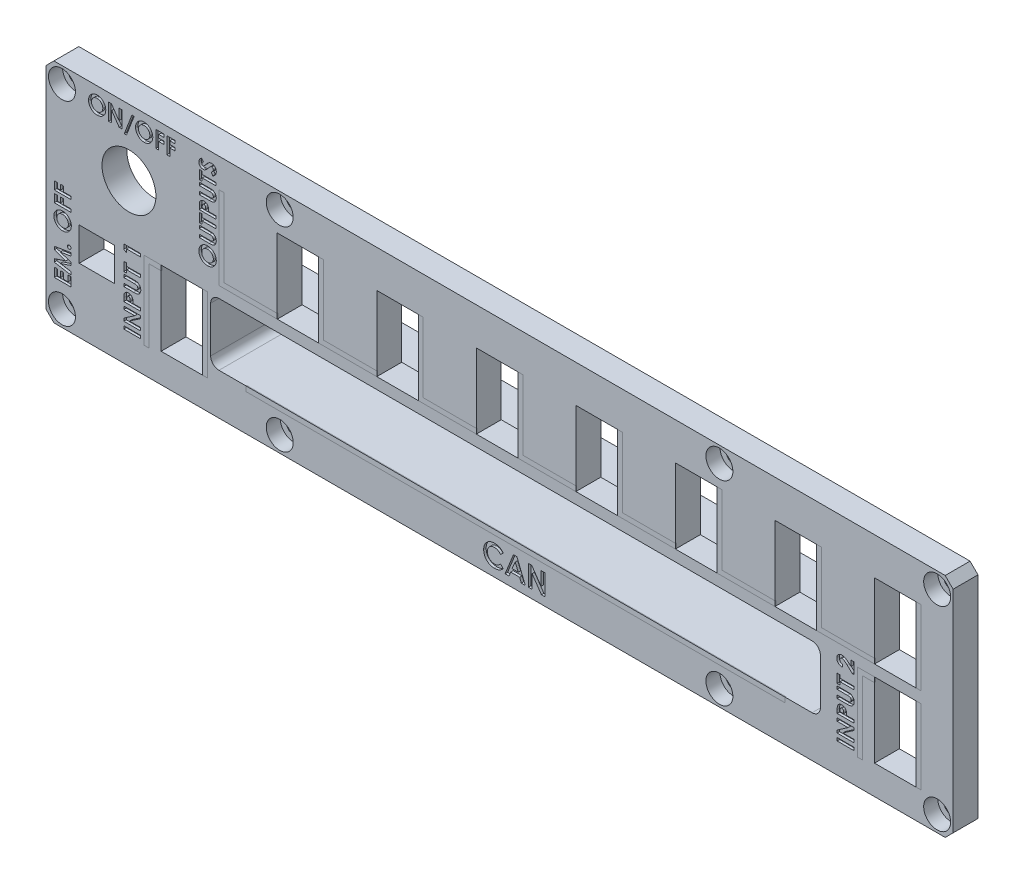
from build123d import *

# Parameters (mm, degrees)
SKETCH1_W                                           = 219
SKETCH1_H                                           = 55
BASE_DEPTH                                          = 6
BASE_CHAMFERS_SIZE                                  = 2
CBORE_FOR_M3_HEX_SOCKET_HEAD_CAP_SCREW2_D           = 3.6
CBORE_FOR_M3_HEX_SOCKET_HEAD_CAP_SCREW2_DEPTH       = 10
CBORE_FOR_M3_HEX_SOCKET_HEAD_CAP_SCREW2_CBORE_D     = 6.5
CBORE_FOR_M3_HEX_SOCKET_HEAD_CAP_SCREW2_CBORE_DEPTH = 3.4
CBORE_FOR_M3_HEX_SOCKET_HEAD_CAP_SCREW2_TIP         = 1.081549114
CLEARANCE_DEPTH                                     = 226.88049938
SKETCH8_W                                           = 10
SKETCH8_H                                           = 18
XT60_OUTPUT_CUTOUTS_DEPTH                           = 226.698571108
SKETCH11_R                                          = 6.5
SWITCH_CUTOUT_DEPTH                                 = 226.698571108
SKETCH10_W                                          = 10
SKETCH10_H                                          = 18
XT60_INPUT_CUTOUTS_DEPTH                            = 226.698571108
BAND_CUTOUT_DEPTH                                   = 0.2
SKETCH13_W                                          = 1.2
SKETCH13_H                                          = 18
OUTPUT_BANDS_DEPTH                                  = 0.2
OUTPUT_BANDS_2_DEPTH                                = 0.2
OUTPUT_BANDS_3_DEPTH                                = 0.2
OUTPUT_BANDS_4_DEPTH                                = 0.2
OUTPUT_BANDS_5_DEPTH                                = 0.2
OUTPUT_BANDS_6_DEPTH                                = 0.2
OUTPUT_BANDS_7_DEPTH                                = 0.2
OUTPUT_BANDS_8_DEPTH                                = 0.2
SKETCH15_W                                          = 147
SKETCH15_H                                          = 15
MOLEX_SLOT_DEPTH                                    = 226.698571108
SKETCH17_W                                          = 8.5
SKETCH17_H                                          = 8
MOLEX_PANELMOUNT_DEPTH                              = 226.698571108
SKETCH9_W                                           = 4
SKETCH9_H                                           = 0.717948718
NAMES_DEPTH                                         = 0.6
FILLET2_R                                           = 2
BOSS_EXTRUDE3_START                                 = 9.5
BOSS_EXTRUDE3_DEPTH                                 = 9.5
SKETCH14_W                                          = 1.2
SKETCH14_H                                          = 18
INPUT_BANDS_DEPTH                                   = 0.2
INPUT_BANDS_2_DEPTH                                 = 0.2
INPUT_BANDS_3_DEPTH                                 = 0.2
INPUT_BANDS_4_DEPTH                                 = 0.2
SKETCH21_W                                          = 130
SKETCH21_H                                          = 1.2
CUT_EXTRUDE4_DEPTH                                  = 0.2
SKETCH22_W                                          = 130
SKETCH22_H                                          = 1.2
BOSS_EXTRUDE4_DEPTH                                 = 0.2
CUT_EXTRUDE5_DEPTH                                  = 0.6


with BuildPart() as part:
    # Sketch1 → base (new body)
    with BuildSketch(Plane.XY):
        with Locations((109.5, 27.5)):
            Rectangle(SKETCH1_W, SKETCH1_H)
    extrude(amount=BASE_DEPTH)

    # base_chamfers
    base_chamfers_edges = [part.edges().sort_by_distance(p)[0] for p in [
        (219, 0, 3),
        (219, 55, 3),
        (0, 0, 3),
        (0, 55, 3),
    ]]
    chamfer(base_chamfers_edges, length=BASE_CHAMFERS_SIZE)

    # CBORE for M3 Hex Socket Head Cap Screw2
    with Locations(Plane.XY.offset(6)):
        with Locations((215, 4), (162.5, 4), (215, 51), (162.5, 51), (56.5, 4), (56.5, 51), (4, 4), (4, 51)):
            CounterBoreHole(CBORE_FOR_M3_HEX_SOCKET_HEAD_CAP_SCREW2_D / 2, CBORE_FOR_M3_HEX_SOCKET_HEAD_CAP_SCREW2_CBORE_D / 2, CBORE_FOR_M3_HEX_SOCKET_HEAD_CAP_SCREW2_CBORE_DEPTH, depth=CBORE_FOR_M3_HEX_SOCKET_HEAD_CAP_SCREW2_DEPTH)
            with Locations((0, 0, -(CBORE_FOR_M3_HEX_SOCKET_HEAD_CAP_SCREW2_DEPTH + CBORE_FOR_M3_HEX_SOCKET_HEAD_CAP_SCREW2_TIP / 2))):  # 118° drill point
                Cone(0, CBORE_FOR_M3_HEX_SOCKET_HEAD_CAP_SCREW2_D / 2, CBORE_FOR_M3_HEX_SOCKET_HEAD_CAP_SCREW2_TIP, mode=Mode.SUBTRACT)

    # Sketch6 → clearance (cut, through all)
    with BuildSketch(Plane.XY.offset(6)):
        Polygon((2, 0), (217, 0), (219, 2), (219, 53), (217, 55), (2, 55), (0, 53), (0, 2), align=None)
        Polygon((2.062132034, 0.15), (216.937867966, 0.15), (218.85, 2.062132034), (218.85, 52.937867966), (216.937867966, 54.85), (2.062132034, 54.85), (0.15, 52.937867966), (0.15, 2.062132034), align=None, mode=Mode.SUBTRACT)
    extrude(amount=-CLEARANCE_DEPTH, mode=Mode.SUBTRACT)

    # Sketch8 → xt60_output_cutouts (cut, through all)
    with BuildSketch(Plane.XY.offset(6)):
        with Locations((180.9, 36.85)):
            Rectangle(SKETCH8_W, SKETCH8_H)
        with Locations((204.9, 36.85)):
            Rectangle(SKETCH8_W, SKETCH8_H)
        with Locations((156.9, 36.85)):
            Rectangle(SKETCH8_W, SKETCH8_H)
        with Locations((132.9, 36.85)):
            Rectangle(SKETCH8_W, SKETCH8_H)
        with Locations((108.9, 36.85)):
            Rectangle(SKETCH8_W, SKETCH8_H)
        with Locations((84.9, 36.85)):
            Rectangle(SKETCH8_W, SKETCH8_H)
        with Locations((60.9, 36.85)):
            Rectangle(SKETCH8_W, SKETCH8_H)
    extrude(amount=-XT60_OUTPUT_CUTOUTS_DEPTH, mode=Mode.SUBTRACT)

    # Sketch11 → switch_cutout (cut, through all)
    with BuildSketch(Plane.XY.offset(6)):
        with Locations((20.15, 38.85)):
            Circle(SKETCH11_R)
    extrude(amount=-SWITCH_CUTOUT_DEPTH, mode=Mode.SUBTRACT)

    # Sketch10 → xt60_input_cutouts (cut, through all)
    with BuildSketch(Plane.XY.offset(6)):
        with Locations((204.9, 16.15)):
            Rectangle(SKETCH10_W, SKETCH10_H)
        with Locations((32.9, 16.15)):
            Rectangle(SKETCH10_W, SKETCH10_H)
    extrude(amount=-XT60_INPUT_CUTOUTS_DEPTH, mode=Mode.SUBTRACT)

    # Sketch12 → band_cutout (cut)
    with BuildSketch(Plane.XY.offset(6)):
        Polygon((41.9, 27.85), (41.9, 47.85), (43.1, 47.85), (43.1, 29.05), (65.9, 29.05), (65.9, 45.85), (67.1, 45.85), (67.1, 29.05), (89.9, 29.05), (89.9, 45.85), (91.1, 45.85), (91.1, 29.05), (113.9, 29.05), (113.9, 45.85), (115.1, 45.85), (115.1, 29.05), (137.9, 29.05), (137.9, 45.85), (139.1, 45.85), (139.1, 29.05), (161.9, 29.05), (161.9, 45.85), (163.1, 45.85), (163.1, 29.05), (185.9, 29.05), (185.9, 45.85), (187.1, 45.85), (187.1, 29.05), (209.9, 29.05), (209.9, 45.85), (211.1, 45.85), (211.1, 29.05), (211.1, 27.85), align=None)
        Polygon((195.82, 6.35), (197.02, 6.35), (197.02, 23.95), (209.9, 23.95), (209.9, 7.15), (211.1, 7.15), (211.1, 25.15), (195.82, 25.15), align=None)
        Polygon((37.9, 23.95), (25.02, 23.95), (25.02, 6.35), (23.82, 6.35), (23.82, 25.15), (39.1, 25.15), (39.1, 7.15), (37.9, 7.15), align=None)
    extrude(amount=-BAND_CUTOUT_DEPTH, mode=Mode.SUBTRACT)

    # Sketch15 → molex_slot (cut, through all)
    with BuildSketch(Plane.XY.offset(6)):
        with Locations((113.35, 17.65)):
            Rectangle(SKETCH15_W, SKETCH15_H)
    extrude(amount=-MOLEX_SLOT_DEPTH, mode=Mode.SUBTRACT)

    # Sketch17 → molex_panelmount (cut, through all)
    with BuildSketch(Plane.XY.offset(6)):
        with Locations((12.4, 19.65)):
            Rectangle(SKETCH17_W, SKETCH17_H)
    extrude(amount=-MOLEX_PANELMOUNT_DEPTH, mode=Mode.SUBTRACT)

    # Sketch9 → names (cut)
    # profile 1 of 31: a face of its own
    with BuildSketch(Plane.XY.offset(6)):
        with BuildLine():
            add(Edge.make_bspline(
                [(36.997435897, 32.691346154), (36.99923689, 32.760890841), (37.002792457, 32.898187804), (37.032420066, 33.100105823), (37.080720927, 33.294676682), (37.147767343, 33.481881097), (37.235731958, 33.660868553), (37.340581263, 33.83338351), (37.466872706, 33.997240968), (37.610108325, 34.15187483), (37.765972209, 34.29473905), (37.933781603, 34.418499393), (38.109325684, 34.524326914), (38.293269724, 34.611389818), (38.486240856, 34.678265944), (38.687434957, 34.724990393), (38.896906519, 34.75504687), (39.039532487, 34.758500946), (39.112019231, 34.76025641)],
                knots=[0, 0, 0, 0, 1.014235534, 2.002330665, 2.970116157, 3.9352621, 4.897279957, 5.875024536, 6.875755618, 7.909865842, 8.947091691, 9.955591861, 10.946663836, 11.933282567, 12.91916997, 13.920121047, 14.942943865, 16, 16, 16, 16], degree=3))
            add(Edge.make_bspline(
                [(39.112019231, 34.76025641), (39.183688993, 34.75838631), (39.32491656, 34.754701217), (39.532460959, 34.726223244), (39.731488099, 34.678682075), (39.922402523, 34.613122303), (40.104241545, 34.527486339), (40.277764189, 34.423469431), (40.442375336, 34.299975837), (40.597381362, 34.159964473), (40.739039302, 34.006778452), (40.863059691, 33.843622592), (40.968125462, 33.672441312), (41.054646326, 33.49336868), (41.119913589, 33.305114292), (41.168719542, 33.109803157), (41.196952425, 32.905846735), (41.200674731, 32.767285939), (41.202564103, 32.696955128)],
                knots=[0, 0, 0, 0, 1.051628416, 2.072267533, 3.067761847, 4.050852917, 5.029392597, 6.012272624, 7.015026456, 8.044749159, 9.073964344, 10.072810436, 11.047668484, 12.017263184, 12.98554948, 13.966731695, 14.967951888, 16, 16, 16, 16], degree=3))
            add(Edge.make_bspline(
                [(41.202564103, 32.696955128), (41.200888903, 32.62339199), (41.197597366, 32.47885048), (41.166560396, 32.267260823), (41.119240401, 32.06482857), (41.050732436, 31.87210839), (40.961715872, 31.689250101), (40.854235165, 31.515433662), (40.726214176, 31.351966326), (40.581514237, 31.199392979), (40.423139704, 31.061177258), (40.255841711, 30.939170565), (40.080885433, 30.83625627), (39.898192328, 30.752429085), (39.708896919, 30.68634317), (39.511846571, 30.639727048), (39.307513822, 30.612189796), (39.168726936, 30.608354017), (39.098397436, 30.606410256)],
                knots=[0, 0, 0, 0, 1.067953136, 2.098381936, 3.099641766, 4.083805132, 5.062469929, 6.048665414, 7.046702845, 8.073106546, 9.098695993, 10.09591865, 11.076726721, 12.041940862, 13.011263376, 13.984305721, 14.978557872, 16, 16, 16, 16], degree=3))
            add(Edge.make_bspline(
                [(39.098397436, 30.606410256), (39.051083498, 30.607020499), (38.957054725, 30.608233257), (38.817707679, 30.622835309), (38.681085215, 30.643871589), (38.547709852, 30.674932915), (38.416482782, 30.712911153), (38.28857309, 30.761472843), (38.163113348, 30.817461291), (38.041509705, 30.882194574), (37.925162849, 30.955375829), (37.813072563, 31.033525894), (37.708172324, 31.119620499), (37.609343313, 31.211900142), (37.516964093, 31.310673281), (37.43113069, 31.416139037), (37.350860755, 31.527539872), (37.277219906, 31.644886032), (37.212125699, 31.767309575), (37.153833496, 31.892109015), (37.10598078, 32.019802965), (37.066581968, 32.149643086), (37.034920242, 32.281445874), (37.013877867, 32.416258923), (36.999281624, 32.552936412), (36.9980526, 32.645100082), (36.997435897, 32.691346154)],
                knots=[0, 0, 0, 0, 1.034634222, 2.056167603, 3.061938024, 4.056975325, 5.049831446, 6.048294015, 7.047371884, 8.053753139, 9.058980286, 10.052730068, 11.041053953, 12.024946181, 13.008838409, 13.997162294, 14.997691456, 16.01096975, 17.025258359, 18.029177048, 19.022170708, 20.005507574, 20.996177714, 21.984639769, 22.988728483, 24, 24, 24, 24], degree=3))
        make_face()
        with BuildLine():
            add(Edge.make_bspline(
                [(37.715384615, 32.680128205), (37.716640464, 32.633324495), (37.719119007, 32.540952701), (37.738002149, 32.405460101), (37.768160674, 32.27538242), (37.81184493, 32.15144073), (37.867443899, 32.033097857), (37.934763314, 31.920144016), (38.016117203, 31.814143384), (38.10713804, 31.713682545), (38.208556169, 31.622932708), (38.317242943, 31.542752364), (38.433016856, 31.47565433), (38.554802395, 31.419459307), (38.683969008, 31.377156909), (38.819504917, 31.347026179), (38.961643659, 31.327984683), (39.058539454, 31.325584478), (39.108012821, 31.324358974)],
                knots=[0, 0, 0, 0, 1.033739768, 2.040188636, 3.016340934, 3.979330865, 4.937572243, 5.900995986, 6.878200029, 7.884839167, 8.891893314, 9.879764717, 10.863503415, 11.843163062, 12.837761627, 13.859916423, 14.907309254, 16, 16, 16, 16], degree=3))
            add(Edge.make_bspline(
                [(39.108012821, 31.324358974), (39.162838855, 31.325987534), (39.270288799, 31.32917924), (39.427060684, 31.351532645), (39.57525603, 31.390118062), (39.714139016, 31.44483724), (39.844491838, 31.514188433), (39.965579924, 31.599133925), (40.07797272, 31.69965999), (40.143609541, 31.777061518), (40.176923077, 31.816346154)],
                knots=[0, 0, 0, 0, 1.078420897, 2.113526272, 3.107597235, 4.084297302, 5.043369457, 6.005430726, 6.9876695, 8, 8, 8, 8], degree=3))
            add(Edge.make_bspline(
                [(40.176923077, 31.816346154), (40.201532608, 31.848530472), (40.250197212, 31.912173991), (40.312570887, 32.013762902), (40.366031348, 32.118379478), (40.409226768, 32.22681318), (40.443203559, 32.338835002), (40.466996947, 32.454429584), (40.481929356, 32.573433136), (40.483714062, 32.653908915), (40.484615385, 32.694551282)],
                knots=[0, 0, 0, 0, 1.023928204, 2.024787132, 3.009472467, 3.9914905, 4.972207045, 5.96565515, 6.972602802, 8, 8, 8, 8], degree=3))
            add(Edge.make_bspline(
                [(40.484615385, 32.694551282), (40.483347024, 32.740549259), (40.480851484, 32.831051726), (40.46222742, 32.964035509), (40.430565821, 33.091375643), (40.38758789, 33.214267965), (40.329925292, 33.331009128), (40.261802631, 33.443456269), (40.179920513, 33.549649083), (40.086981788, 33.649548803), (39.985207266, 33.741179984), (39.876484791, 33.822015992), (39.761825998, 33.890217792), (39.641249854, 33.945984308), (39.514888872, 33.989667935), (39.382355966, 34.019493791), (39.244254964, 34.038680439), (39.150278831, 34.041083488), (39.102403846, 34.042307692)],
                knots=[0, 0, 0, 0, 1.026460056, 2.019592442, 2.989754624, 3.951362471, 4.919177453, 5.890456226, 6.881277895, 7.906300149, 8.932084862, 9.933608786, 10.925308803, 11.904168404, 12.893913482, 13.903284022, 14.931853825, 16, 16, 16, 16], degree=3))
            add(Edge.make_bspline(
                [(39.102403846, 34.042307692), (39.054802414, 34.041045482), (38.961106253, 34.038561014), (38.823385188, 34.019831642), (38.691592141, 33.988694697), (38.565387385, 33.944688242), (38.444108354, 33.889865357), (38.328807646, 33.820998686), (38.219585016, 33.739580949), (38.117089807, 33.647100531), (38.022896961, 33.546457837), (37.941156302, 33.438403485), (37.870125851, 33.325966125), (37.814483564, 33.206564543), (37.770153445, 33.082641947), (37.737508116, 32.95344206), (37.719251662, 32.818475555), (37.716685121, 32.726655051), (37.715384615, 32.680128205)],
                knots=[0, 0, 0, 0, 1.055040155, 2.076685641, 3.074845078, 4.052329834, 5.035358467, 6.020382375, 7.023447318, 8.050688466, 9.077178457, 10.074336316, 11.0503314, 12.019748348, 12.988025369, 13.964577102, 14.968620271, 16, 16, 16, 16], degree=3))
        make_face(mode=Mode.SUBTRACT)
    # profile 2 of 31: a face of its own
    with BuildSketch(Plane.XY.offset(6)):
        with BuildLine():
            Line((37.1, 35.478205128), (37.1, 36.196153846))
            Line((37.1, 36.196153846), (39.702564103, 36.196153846))
            add(Edge.make_bspline(
                [(39.702564103, 36.196153846), (39.729546172, 36.196194472), (39.781661761, 36.196272941), (39.85643356, 36.200026511), (39.92541937, 36.203564203), (39.988060006, 36.209583473), (40.044549915, 36.219025124), (40.095097224, 36.227840234), (40.139251464, 36.239925912), (40.189544941, 36.25802427), (40.246044271, 36.286279897), (40.305596884, 36.331095819), (40.358603737, 36.384613619), (40.403110764, 36.447639009), (40.440755319, 36.518004666), (40.46565404, 36.5970973), (40.482542395, 36.682345726), (40.483911465, 36.741738367), (40.484615385, 36.772275641)],
                knots=[0, 0, 0, 0, 1.155195489, 2.231248153, 3.20507519, 4.113220553, 4.92363642, 5.657123012, 6.309133385, 6.880755525, 7.944644177, 8.999147208, 10.058600405, 11.156792429, 12.29246015, 13.460660758, 14.694375292, 16, 16, 16, 16], degree=3))
            add(Edge.make_bspline(
                [(40.484615385, 36.772275641), (40.483669728, 36.804682541), (40.481825857, 36.86787051), (40.463726271, 36.958756344), (40.434905531, 37.042962582), (40.393770991, 37.118706302), (40.344464031, 37.185912088), (40.288238659, 37.242800479), (40.224982676, 37.287696238), (40.166624355, 37.316958718), (40.112910253, 37.333385558), (40.06491995, 37.345708116), (40.008552406, 37.354655838), (39.944199122, 37.363032749), (39.871391217, 37.36778195), (39.790509283, 37.37319056), (39.701504109, 37.375130133), (39.639529424, 37.375465922), (39.607211538, 37.375641026)],
                knots=[0, 0, 0, 0, 1.26131785, 2.459356261, 3.594833267, 4.716926138, 5.803419038, 6.833631221, 7.818372604, 8.814377287, 9.360705024, 10.004324776, 10.743421339, 11.582437492, 12.532246195, 13.585177397, 14.740744533, 16, 16, 16, 16], degree=3))
            Line((39.607211538, 37.375641026), (37.1, 37.375641026))
            Line((37.1, 37.375641026), (37.1, 38.093589744))
            Line((37.1, 38.093589744), (39.486217949, 38.093589744))
            add(Edge.make_bspline(
                [(39.486217949, 38.093589744), (39.53456261, 38.093490043), (39.62752468, 38.09329833), (39.761117715, 38.090354183), (39.883133524, 38.084086628), (39.993607759, 38.078822606), (40.092391591, 38.068634917), (40.179906862, 38.05802174), (40.255843418, 38.044494321), (40.342288015, 38.024366375), (40.441825445, 37.989631246), (40.556440155, 37.933634863), (40.668648363, 37.862546518), (40.777248159, 37.778541381), (40.878036769, 37.683625166), (40.966767773, 37.580314964), (41.040598007, 37.46908469), (41.100293134, 37.350448123), (41.146258021, 37.223153356), (41.178747174, 37.086900161), (41.199420922, 36.940909356), (41.201495374, 36.840190303), (41.202564103, 36.788301282)],
                knots=[0, 0, 0, 0, 1.170930413, 2.251584989, 3.235934929, 4.130173708, 4.929654547, 5.640582214, 6.264911921, 6.796838084, 7.789064304, 8.810388137, 9.880124863, 11.000704429, 12.131026409, 13.227749078, 14.29171941, 15.356377855, 16.43689688, 17.561893293, 18.743922147, 20, 20, 20, 20], degree=3))
            add(Edge.make_bspline(
                [(41.202564103, 36.788301282), (41.201981655, 36.753821199), (41.200832498, 36.685792704), (41.190752852, 36.585736217), (41.17577709, 36.489045077), (41.154352672, 36.395667992), (41.125106848, 36.305926945), (41.090545414, 36.219241106), (41.051000573, 36.135296464), (41.003008391, 36.056716401), (40.952598124, 35.981570474), (40.897441503, 35.912379693), (40.839984479, 35.848080215), (40.778911898, 35.789418888), (40.714658815, 35.736340883), (40.647162334, 35.68888745), (40.576406723, 35.647147186), (40.501122517, 35.610064414), (40.417481161, 35.578328489), (40.322510393, 35.551560497), (40.21496896, 35.528290491), (40.094148399, 35.510675004), (39.960598827, 35.495149146), (39.813810586, 35.485089027), (39.654258641, 35.479896263), (39.543646874, 35.478783084), (39.486217949, 35.478205128)],
                knots=[0, 0, 0, 0, 1.001237316, 1.975420686, 2.917953599, 3.841913885, 4.754568974, 5.656377887, 6.55158913, 7.445656762, 8.327865759, 9.178398172, 10.013362476, 10.830881591, 11.635451955, 12.431789376, 13.224756564, 14.019278107, 14.866442763, 15.819105778, 16.882716987, 18.059987251, 19.363897986, 20.787153213, 22.331910422, 24, 24, 24, 24], degree=3))
            Line((39.486217949, 35.478205128), (37.1, 35.478205128))
        make_face()
    # profile 3 of 31: a face of its own
    with BuildSketch(Plane.XY.offset(6)):
        Polygon((37.1, 38.606410256), (37.1, 40.76025641), (37.817948718, 40.76025641), (37.817948718, 40.042307692), (41.1, 40.042307692), (41.1, 39.324358974), (37.817948718, 39.324358974), (37.817948718, 38.606410256), align=None)
    # profile 4 of 31: a face of its own
    with BuildSketch(Plane.XY.offset(6)):
        with BuildLine():
            Line((37.1, 41.324358974), (37.1, 42.125641026))
            add(Edge.make_bspline(
                [(37.1, 42.125641026), (37.100234351, 42.177995756), (37.100686462, 42.278999004), (37.106168927, 42.424653993), (37.115993811, 42.559027871), (37.128135895, 42.682089684), (37.145158349, 42.793789096), (37.164674102, 42.894265135), (37.188447224, 42.983541394), (37.216674337, 43.062615777), (37.24992389, 43.133604369), (37.285438096, 43.200703539), (37.327534688, 43.262903401), (37.373179262, 43.321664229), (37.423321413, 43.376541528), (37.477762968, 43.427941948), (37.537295122, 43.475336209), (37.601507751, 43.518427178), (37.669093531, 43.557538804), (37.740206587, 43.591703651), (37.814950391, 43.619417713), (37.892843884, 43.642665957), (37.973882998, 43.661339282), (38.058566318, 43.673768815), (38.146302501, 43.682211587), (38.206015804, 43.682956544), (38.236217949, 43.683333333)],
                knots=[0, 0, 0, 0, 1.698787518, 3.27731721, 4.728409951, 6.070286353, 7.288646904, 8.393455548, 9.389990496, 10.283725379, 11.113616976, 11.931887102, 12.744353494, 13.547053751, 14.344590688, 15.153907614, 15.974148981, 16.810666655, 17.660988447, 18.506082349, 19.367288142, 20.244738011, 21.142497992, 22.06302001, 23.020302899, 24, 24, 24, 24], degree=3))
            add(Edge.make_bspline(
                [(38.236217949, 43.683333333), (38.269629862, 43.682788166), (38.335288377, 43.681716847), (38.431535709, 43.671214464), (38.523298813, 43.653273067), (38.611351601, 43.62982463), (38.694245208, 43.59712734), (38.773958234, 43.559772611), (38.848253095, 43.513812978), (38.918069146, 43.461302119), (38.983936624, 43.403934401), (39.044092514, 43.340440511), (39.098518848, 43.271568313), (39.149569284, 43.199230489), (39.193156223, 43.120446318), (39.233813406, 43.03797376), (39.268263423, 42.949736574), (39.286345355, 42.888339568), (39.295512821, 42.857211538)],
                knots=[0, 0, 0, 0, 1.101964615, 2.165495883, 3.188506962, 4.184641065, 5.166448333, 6.124117473, 7.085225874, 8.042124548, 9.003636759, 9.963451826, 10.9225791, 11.897800977, 12.880319672, 13.889154746, 14.929810112, 16, 16, 16, 16], degree=3))
            add(Edge.make_bspline(
                [(39.295512821, 42.857211538), (39.300614596, 42.836706143), (39.311666685, 42.792284854), (39.322887329, 42.718779821), (39.333204021, 42.634072988), (39.342069969, 42.537890443), (39.348096748, 42.430176733), (39.352803394, 42.311036155), (39.356225612, 42.180414715), (39.356347047, 42.089585731), (39.356410256, 42.042307692)],
                knots=[0, 0, 0, 0, 0.618981996, 1.340914327, 2.176866532, 3.120127938, 4.170906482, 5.338178032, 6.614476169, 8, 8, 8, 8], degree=3))
            Line((39.356410256, 42.042307692), (41.1, 42.042307692))
            Line((41.1, 42.042307692), (41.1, 41.324358974))
            Line((41.1, 41.324358974), (37.1, 41.324358974))
        make_face()
        with BuildLine():
            Line((38.638461538, 42.042307692), (38.638461538, 42.296314103))
            add(Edge.make_bspline(
                [(38.638461538, 42.296314103), (38.638168512, 42.342534634), (38.637629339, 42.427581098), (38.629830788, 42.543723774), (38.617923133, 42.637060486), (38.600838772, 42.710792336), (38.57492833, 42.769027438), (38.544902375, 42.819194609), (38.506991239, 42.862581698), (38.46294146, 42.899351903), (38.413320211, 42.92923095), (38.358260445, 42.950234029), (38.29854731, 42.963478562), (38.256856627, 42.964737296), (38.235416667, 42.965384615)],
                knots=[0, 0, 0, 0, 1.862197296, 3.426470689, 4.686743892, 5.65255712, 6.462325617, 7.244961981, 8.000258385, 8.771939908, 9.549006364, 10.32248703, 11.137317743, 12, 12, 12, 12], degree=3))
            add(Edge.make_bspline(
                [(38.235416667, 42.965384615), (38.216679886, 42.964757735), (38.180326026, 42.963541438), (38.127895292, 42.95448304), (38.079114892, 42.940423945), (38.034664813, 42.918937345), (37.993508296, 42.892850655), (37.956926554, 42.859756444), (37.923736043, 42.821592017), (37.906189904, 42.792077895), (37.897275641, 42.777083333)],
                knots=[0, 0, 0, 0, 1.102449765, 2.139017612, 3.12397484, 4.080535277, 5.035673127, 5.982361139, 6.974944601, 8, 8, 8, 8], degree=3))
            add(Edge.make_bspline(
                [(37.897275641, 42.777083333), (37.890853873, 42.764385284), (37.877257675, 42.73750091), (37.8614511, 42.691714216), (37.848116513, 42.63887707), (37.837048934, 42.578632762), (37.828459344, 42.511221624), (37.821890456, 42.436655683), (37.81924885, 42.354825208), (37.818394049, 42.297917009), (37.817948718, 42.268269231)],
                knots=[0, 0, 0, 0, 0.656809284, 1.390599849, 2.23162475, 3.173112763, 4.218524733, 5.370385145, 6.63003504, 8, 8, 8, 8], degree=3))
            Line((37.817948718, 42.268269231), (37.817948718, 42.042307692))
            Line((37.817948718, 42.042307692), (38.638461538, 42.042307692))
        make_face(mode=Mode.SUBTRACT)
    # profile 5 of 31: a face of its own
    with BuildSketch(Plane.XY.offset(6)):
        with BuildLine():
            Line((37.1, 44.452564103), (37.1, 45.170512821))
            Line((37.1, 45.170512821), (39.702564103, 45.170512821))
            add(Edge.make_bspline(
                [(39.702564103, 45.170512821), (39.729546172, 45.170553447), (39.781661761, 45.170631915), (39.85643356, 45.174385485), (39.92541937, 45.177923177), (39.988060006, 45.183942448), (40.044549915, 45.193384098), (40.095097224, 45.202199208), (40.139251464, 45.214284886), (40.189544941, 45.232383245), (40.246044271, 45.260638872), (40.305596884, 45.305454793), (40.358603737, 45.358972594), (40.403110764, 45.421997983), (40.440755319, 45.492363641), (40.46565404, 45.571456275), (40.482542395, 45.6567047), (40.483911465, 45.716097341), (40.484615385, 45.746634615)],
                knots=[0, 0, 0, 0, 1.155195489, 2.231248153, 3.20507519, 4.113220553, 4.92363642, 5.657123012, 6.309133385, 6.880755525, 7.944644177, 8.999147208, 10.058600405, 11.156792429, 12.29246015, 13.460660758, 14.694375292, 16, 16, 16, 16], degree=3))
            add(Edge.make_bspline(
                [(40.484615385, 45.746634615), (40.483669728, 45.779041515), (40.481825857, 45.842229484), (40.463726271, 45.933115318), (40.434905531, 46.017321556), (40.393770991, 46.093065276), (40.344464031, 46.160271063), (40.288238659, 46.217159453), (40.224982676, 46.262055212), (40.166624355, 46.291317692), (40.112910253, 46.307744532), (40.06491995, 46.320067091), (40.008552406, 46.329014812), (39.944199122, 46.337391723), (39.871391217, 46.342140924), (39.790509283, 46.347549535), (39.701504109, 46.349489108), (39.639529424, 46.349824896), (39.607211538, 46.35)],
                knots=[0, 0, 0, 0, 1.26131785, 2.459356261, 3.594833267, 4.716926138, 5.803419038, 6.833631221, 7.818372604, 8.814377287, 9.360705024, 10.004324776, 10.743421339, 11.582437492, 12.532246195, 13.585177397, 14.740744533, 16, 16, 16, 16], degree=3))
            Line((39.607211538, 46.35), (37.1, 46.35))
            Line((37.1, 46.35), (37.1, 47.067948718))
            Line((37.1, 47.067948718), (39.486217949, 47.067948718))
            add(Edge.make_bspline(
                [(39.486217949, 47.067948718), (39.53456261, 47.067849018), (39.62752468, 47.067657304), (39.761117715, 47.064713158), (39.883133524, 47.058445603), (39.993607759, 47.05318158), (40.092391591, 47.042993892), (40.179906862, 47.032380714), (40.255843418, 47.018853295), (40.342288015, 46.998725349), (40.441825445, 46.963990221), (40.556440155, 46.907993837), (40.668648363, 46.836905492), (40.777248159, 46.752900355), (40.878036769, 46.65798414), (40.966767773, 46.554673938), (41.040598007, 46.443443664), (41.100293134, 46.324807097), (41.146258021, 46.19751233), (41.178747174, 46.061259136), (41.199420922, 45.91526833), (41.201495374, 45.814549278), (41.202564103, 45.762660256)],
                knots=[0, 0, 0, 0, 1.170930413, 2.251584989, 3.235934929, 4.130173708, 4.929654547, 5.640582214, 6.264911921, 6.796838084, 7.789064304, 8.810388137, 9.880124863, 11.000704429, 12.131026409, 13.227749078, 14.29171941, 15.356377855, 16.43689688, 17.561893293, 18.743922147, 20, 20, 20, 20], degree=3))
            add(Edge.make_bspline(
                [(41.202564103, 45.762660256), (41.201981655, 45.728180174), (41.200832498, 45.660151678), (41.190752852, 45.560095191), (41.17577709, 45.463404051), (41.154352672, 45.370026966), (41.125106848, 45.28028592), (41.090545414, 45.193600081), (41.051000573, 45.109655438), (41.003008391, 45.031075375), (40.952598124, 44.955929449), (40.897441503, 44.886738668), (40.839984479, 44.822439189), (40.778911898, 44.763777862), (40.714658815, 44.710699857), (40.647162334, 44.663246424), (40.576406723, 44.62150616), (40.501122517, 44.584423388), (40.417481161, 44.552687464), (40.322510393, 44.525919471), (40.21496896, 44.502649465), (40.094148399, 44.485033978), (39.960598827, 44.46950812), (39.813810586, 44.459448001), (39.654258641, 44.454255237), (39.543646874, 44.453142058), (39.486217949, 44.452564103)],
                knots=[0, 0, 0, 0, 1.001237316, 1.975420686, 2.917953599, 3.841913885, 4.754568974, 5.656377887, 6.55158913, 7.445656762, 8.327865759, 9.178398172, 10.013362476, 10.830881591, 11.635451955, 12.431789376, 13.224756564, 14.019278107, 14.866442763, 15.819105778, 16.882716987, 18.059987251, 19.363897986, 20.787153213, 22.331910422, 24, 24, 24, 24], degree=3))
            Line((39.486217949, 44.452564103), (37.1, 44.452564103))
        make_face()
    # profile 6 of 31: a face of its own
    with BuildSketch(Plane.XY.offset(6)):
        Polygon((37.1, 47.580769231), (37.1, 49.734615385), (37.817948718, 49.734615385), (37.817948718, 49.016666667), (41.1, 49.016666667), (41.1, 48.298717949), (37.817948718, 48.298717949), (37.817948718, 47.580769231), align=None)
    # profile 7 of 31: a face of its own
    with BuildSketch(Plane.XY.offset(6)):
        with BuildLine():
            Line((37.634455128, 52.35), (38.125641026, 51.813141026))
            add(Edge.make_bspline(
                [(38.125641026, 51.813141026), (38.093201738, 51.790144289), (38.03092283, 51.745993762), (37.947529904, 51.674430363), (37.876389532, 51.603190109), (37.817798906, 51.531613003), (37.772114007, 51.459064613), (37.739768594, 51.385670871), (37.719206308, 51.311847868), (37.716645808, 51.262250206), (37.715384615, 51.237820513)],
                knots=[0, 0, 0, 0, 1.299362458, 2.494594718, 3.587462134, 4.587049575, 5.512617175, 6.380583204, 7.202344345, 8, 8, 8, 8], degree=3))
            add(Edge.make_bspline(
                [(37.715384615, 51.237820513), (37.716160004, 51.215021948), (37.717657076, 51.17100391), (37.73328668, 51.108545219), (37.758543278, 51.052415534), (37.79343124, 51.004109998), (37.83509759, 50.965249245), (37.879453453, 50.935032688), (37.927815949, 50.917473788), (37.960983795, 50.915218878), (37.977403846, 50.914102564)],
                knots=[0, 0, 0, 0, 1.184157716, 2.286297433, 3.324836695, 4.370048774, 5.362957217, 6.276446515, 7.146738784, 8, 8, 8, 8], degree=3))
            add(Edge.make_bspline(
                [(37.977403846, 50.914102564), (37.994052975, 50.914809189), (38.027582006, 50.916232234), (38.076722977, 50.929976913), (38.124739426, 50.950694069), (38.153969324, 50.970490156), (38.168910256, 50.980608974)],
                knots=[0, 0, 0, 0, 0.967525499, 1.948461899, 2.951351359, 4, 4, 4, 4], degree=3))
            add(Edge.make_bspline(
                [(38.168910256, 50.980608974), (38.180490541, 50.989843819), (38.20730085, 51.01122404), (38.250404173, 51.050790288), (38.301351309, 51.102454365), (38.361200826, 51.164932364), (38.430520959, 51.238006333), (38.508153774, 51.32280917), (38.593344225, 51.419960479), (38.653403062, 51.488101803), (38.684935897, 51.523878205)],
                knots=[0, 0, 0, 0, 0.473854981, 1.097054127, 1.870604305, 2.795416232, 3.865517794, 5.093525133, 6.47400653, 8, 8, 8, 8], degree=3))
            add(Edge.make_bspline(
                [(38.684935897, 51.523878205), (38.714047799, 51.557533304), (38.769296141, 51.62140369), (38.847841245, 51.712163391), (38.918189203, 51.792445379), (38.980866803, 51.86151952), (39.033292901, 51.921449913), (39.078692822, 51.969585976), (39.115080518, 52.007987831), (39.137083893, 52.029795584), (39.146474359, 52.039102564)],
                knots=[0, 0, 0, 0, 1.543627419, 2.929484142, 4.163674036, 5.24627963, 6.164986907, 6.925413438, 7.541394495, 8, 8, 8, 8], degree=3))
            add(Edge.make_bspline(
                [(39.146474359, 52.039102564), (39.184693249, 52.074412929), (39.258163377, 52.14229185), (39.371990145, 52.230564563), (39.483010237, 52.302896314), (39.593037995, 52.359506014), (39.704613843, 52.401866797), (39.820144084, 52.431544129), (39.940505902, 52.449588286), (40.022480336, 52.451564533), (40.063942308, 52.452564103)],
                knots=[0, 0, 0, 0, 1.206593015, 2.319495511, 3.336910718, 4.276265636, 5.184178927, 6.099356736, 7.038670786, 8, 8, 8, 8], degree=3))
            add(Edge.make_bspline(
                [(40.063942308, 52.452564103), (40.104340503, 52.451848097), (40.183603267, 52.450443266), (40.299592518, 52.43323679), (40.410599252, 52.408701359), (40.515415621, 52.3707653), (40.615761925, 52.324528981), (40.710075936, 52.266565363), (40.799308934, 52.198493975), (40.881878026, 52.120477786), (40.956767714, 52.034167381), (41.023569156, 51.941647283), (41.078284058, 51.841658404), (41.125142702, 51.736192204), (41.158488181, 51.623323163), (41.184722112, 51.505108386), (41.20009156, 51.380319161), (41.201728047, 51.295020218), (41.202564103, 51.251442308)],
                knots=[0, 0, 0, 0, 1.043169307, 2.046737005, 3.02462096, 3.976528701, 4.921503154, 5.875710796, 6.831116189, 7.817539083, 8.805892356, 9.780872653, 10.7604363, 11.74661763, 12.757588865, 13.796088471, 14.874055702, 16, 16, 16, 16], degree=3))
            add(Edge.make_bspline(
                [(41.202564103, 51.251442308), (41.201957637, 51.217231541), (41.200756488, 51.149474604), (41.190936214, 51.049614362), (41.175121807, 50.953175594), (41.152334664, 50.860324637), (41.123855673, 50.770335052), (41.087499577, 50.684084039), (41.045704722, 50.60095175), (40.99757306, 50.521109073), (40.941640247, 50.445059491), (40.880095862, 50.370671745), (40.809958397, 50.300396153), (40.732589571, 50.232657788), (40.647514876, 50.168330767), (40.556025261, 50.105218866), (40.456392503, 50.046152342), (40.386500544, 50.009663389), (40.350801282, 49.991025641)],
                knots=[0, 0, 0, 0, 1.016956594, 2.014157282, 2.980233409, 3.920138626, 4.854357287, 5.783465618, 6.699725051, 7.61900777, 8.551402113, 9.504102091, 10.486778735, 11.499758944, 12.559144124, 13.656050795, 14.802762778, 16, 16, 16, 16], degree=3))
            Line((40.350801282, 49.991025641), (39.971794872, 50.622435897))
            add(Edge.make_bspline(
                [(39.971794872, 50.622435897), (40.012318316, 50.645748824), (40.090005222, 50.690441696), (40.194387427, 50.766177947), (40.283773507, 50.843765869), (40.356583557, 50.924999226), (40.413791142, 51.008890251), (40.454675651, 51.095844157), (40.479983116, 51.185922036), (40.483073742, 51.247278994), (40.484615385, 51.277884615)],
                knots=[0, 0, 0, 0, 1.283663364, 2.460892379, 3.537111102, 4.529833553, 5.449777664, 6.316464042, 7.160231139, 8, 8, 8, 8], degree=3))
            add(Edge.make_bspline(
                [(40.484615385, 51.277884615), (40.483356395, 51.309014914), (40.480913773, 51.369412226), (40.458352005, 51.455621661), (40.422928373, 51.534661735), (40.372383737, 51.602983391), (40.314047544, 51.660833862), (40.249145861, 51.70353083), (40.178923808, 51.730353353), (40.13014295, 51.733189144), (40.105608974, 51.734615385)],
                knots=[0, 0, 0, 0, 1.13588714, 2.203786484, 3.234766741, 4.283437687, 5.291419208, 6.222934724, 7.106237994, 8, 8, 8, 8], degree=3))
            add(Edge.make_bspline(
                [(40.105608974, 51.734615385), (40.082784102, 51.73329831), (40.036417559, 51.730622799), (39.967477965, 51.710915809), (39.898569724, 51.680107774), (39.84204932, 51.643659695), (39.794726318, 51.606569212), (39.753723077, 51.571102343), (39.708421675, 51.52791308), (39.658765125, 51.47711093), (39.604316288, 51.419367123), (39.545080496, 51.354633017), (39.481579545, 51.282167338), (39.438323325, 51.230948453), (39.415705128, 51.204166667)],
                knots=[0, 0, 0, 0, 0.916159276, 1.861089862, 2.860218735, 3.940849679, 4.552606315, 5.27541173, 6.11797699, 7.06649574, 8.129236253, 9.306560635, 10.591630461, 12, 12, 12, 12], degree=3))
            add(Edge.make_bspline(
                [(39.415705128, 51.204166667), (39.372627674, 51.153253382), (39.289949001, 51.055535379), (39.167834719, 50.917448122), (39.053709435, 50.793016755), (38.946154929, 50.683326383), (38.847181073, 50.58694589), (38.755909215, 50.504633246), (38.671696532, 50.436829577), (38.571283599, 50.366449834), (38.450011543, 50.298768892), (38.304199615, 50.240163524), (38.15825939, 50.202498798), (38.060148457, 50.198246698), (38.011858974, 50.196153846)],
                knots=[0, 0, 0, 0, 1.345561566, 2.582539916, 3.71901348, 4.751744315, 5.681651107, 6.506005906, 7.230637833, 7.861516384, 8.978504332, 10.023243174, 11.027054763, 12, 12, 12, 12], degree=3))
            add(Edge.make_bspline(
                [(38.011858974, 50.196153846), (37.977613136, 50.197021514), (37.910145154, 50.198730912), (37.810943054, 50.213978474), (37.715222392, 50.236767789), (37.623327536, 50.269859828), (37.535391726, 50.312825914), (37.450915554, 50.364944307), (37.370785824, 50.427435275), (37.294214333, 50.496963214), (37.224956003, 50.574491367), (37.163860061, 50.656993648), (37.11197901, 50.744108222), (37.070332559, 50.836170732), (37.037273513, 50.932429229), (37.014114326, 51.033126898), (37.00026765, 51.138074567), (36.998391575, 51.209466235), (36.997435897, 51.245833333)],
                knots=[0, 0, 0, 0, 1.010608097, 1.99100651, 2.956992389, 3.912457524, 4.868345712, 5.842283282, 6.837666818, 7.864758285, 8.892394644, 9.901925088, 10.892014243, 11.880216914, 12.880338321, 13.892361018, 14.926363314, 16, 16, 16, 16], degree=3))
            add(Edge.make_bspline(
                [(36.997435897, 51.245833333), (36.999159934, 51.292962379), (37.002594398, 51.386848451), (37.029452094, 51.525661051), (37.071685191, 51.661250073), (37.122645604, 51.770501681), (37.171986322, 51.85745142), (37.21748636, 51.924028756), (37.269410621, 51.992170745), (37.329222559, 52.060822633), (37.394960314, 52.131650931), (37.468139194, 52.203609226), (37.548006381, 52.277464039), (37.605134063, 52.325397774), (37.634455128, 52.35)],
                knots=[0, 0, 0, 0, 1.282949271, 2.555771389, 3.837399776, 5.142782039, 5.830402679, 6.558840402, 7.337330299, 8.162747002, 9.037840561, 9.968992266, 10.957575255, 12, 12, 12, 12], degree=3))
        make_face()
    # profile 8 of 31: a face of its own
    with BuildSketch(Plane.XY.offset(6)):
        Polygon((18.9, 23.963301282), (18.9, 25.073076923), (22.9, 25.073076923), (22.9, 24.355128205), (19.566666667, 24.355128205), (19.566666667, 23.534615385), align=None)
    # profile 9 of 31: a face of its own
    with BuildSketch(Plane.XY.offset(6)):
        Polygon((18.9, 19.278205128), (18.9, 21.432051282), (19.617948718, 21.432051282), (19.617948718, 20.714102564), (22.9, 20.714102564), (22.9, 19.996153846), (19.617948718, 19.996153846), (19.617948718, 19.278205128), align=None)
    # profile 10 of 31: a face of its own
    with BuildSketch(Plane.XY.offset(6)):
        with BuildLine():
            Line((18.9, 16.15), (18.9, 16.867948718))
            Line((18.9, 16.867948718), (21.502564103, 16.867948718))
            add(Edge.make_bspline(
                [(21.502564103, 16.867948718), (21.529546172, 16.867989344), (21.581661761, 16.868067813), (21.65643356, 16.871821382), (21.72541937, 16.875359074), (21.788060006, 16.881378345), (21.844549915, 16.890819996), (21.895097224, 16.899635105), (21.939251464, 16.911720784), (21.989544941, 16.929819142), (22.046044271, 16.958074769), (22.105596884, 17.00289069), (22.158603737, 17.056408491), (22.203110764, 17.11943388), (22.240755319, 17.189799538), (22.26565404, 17.268892172), (22.282542395, 17.354140597), (22.283911465, 17.413533238), (22.284615385, 17.444070513)],
                knots=[0, 0, 0, 0, 1.155195489, 2.231248153, 3.20507519, 4.113220553, 4.92363642, 5.657123012, 6.309133385, 6.880755525, 7.944644177, 8.999147208, 10.058600405, 11.156792429, 12.29246015, 13.460660758, 14.694375292, 16, 16, 16, 16], degree=3))
            add(Edge.make_bspline(
                [(22.284615385, 17.444070513), (22.283669728, 17.476477413), (22.281825857, 17.539665381), (22.263726271, 17.630551215), (22.234905531, 17.714757454), (22.193770991, 17.790501174), (22.144464031, 17.85770696), (22.088238659, 17.914595351), (22.024982676, 17.959491109), (21.966624355, 17.98875359), (21.912910253, 18.00518043), (21.86491995, 18.017502988), (21.808552406, 18.02645071), (21.744199122, 18.034827621), (21.671391217, 18.039576822), (21.590509283, 18.044985432), (21.501504109, 18.046925005), (21.439529424, 18.047260794), (21.407211538, 18.047435897)],
                knots=[0, 0, 0, 0, 1.26131785, 2.459356261, 3.594833267, 4.716926138, 5.803419038, 6.833631221, 7.818372604, 8.814377287, 9.360705024, 10.004324776, 10.743421339, 11.582437492, 12.532246195, 13.585177397, 14.740744533, 16, 16, 16, 16], degree=3))
            Line((21.407211538, 18.047435897), (18.9, 18.047435897))
            Line((18.9, 18.047435897), (18.9, 18.765384615))
            Line((18.9, 18.765384615), (21.286217949, 18.765384615))
            add(Edge.make_bspline(
                [(21.286217949, 18.765384615), (21.33456261, 18.765284915), (21.42752468, 18.765093201), (21.561117715, 18.762149055), (21.683133524, 18.7558815), (21.793607759, 18.750617477), (21.892391591, 18.740429789), (21.979906862, 18.729816611), (22.055843418, 18.716289193), (22.142288015, 18.696161247), (22.241825445, 18.661426118), (22.356440155, 18.605429735), (22.468648363, 18.53434139), (22.577248159, 18.450336252), (22.678036769, 18.355420038), (22.766767773, 18.252109836), (22.840598007, 18.140879562), (22.900293134, 18.022242994), (22.946258021, 17.894948227), (22.978747174, 17.758695033), (22.999420922, 17.612704228), (23.001495374, 17.511985175), (23.002564103, 17.460096154)],
                knots=[0, 0, 0, 0, 1.170930413, 2.251584989, 3.235934929, 4.130173708, 4.929654547, 5.640582214, 6.264911921, 6.796838084, 7.789064304, 8.810388137, 9.880124863, 11.000704429, 12.131026409, 13.227749078, 14.29171941, 15.356377855, 16.43689688, 17.561893293, 18.743922147, 20, 20, 20, 20], degree=3))
            add(Edge.make_bspline(
                [(23.002564103, 17.460096154), (23.001981655, 17.425616071), (23.000832498, 17.357587575), (22.990752852, 17.257531089), (22.97577709, 17.160839949), (22.954352672, 17.067462864), (22.925106848, 16.977721817), (22.890545414, 16.891035978), (22.851000573, 16.807091336), (22.803008391, 16.728511273), (22.752598124, 16.653365346), (22.697441503, 16.584174565), (22.639984479, 16.519875087), (22.578911898, 16.461213759), (22.514658815, 16.408135754), (22.447162334, 16.360682321), (22.376406723, 16.318942058), (22.301122517, 16.281859286), (22.217481161, 16.250123361), (22.122510393, 16.223355369), (22.01496896, 16.200085362), (21.894148399, 16.182469876), (21.760598827, 16.166944017), (21.613810586, 16.156883899), (21.454258641, 16.151691135), (21.343646874, 16.150577955), (21.286217949, 16.15)],
                knots=[0, 0, 0, 0, 1.001237316, 1.975420686, 2.917953599, 3.841913885, 4.754568974, 5.656377887, 6.55158913, 7.445656762, 8.327865759, 9.178398172, 10.013362476, 10.830881591, 11.635451955, 12.431789376, 13.224756564, 14.019278107, 14.866442763, 15.819105778, 16.882716987, 18.059987251, 19.363897986, 20.787153213, 22.331910422, 24, 24, 24, 24], degree=3))
            Line((21.286217949, 16.15), (18.9, 16.15))
        make_face()
    # profile 11 of 31: a face of its own
    with BuildSketch(Plane.XY.offset(6)):
        with BuildLine():
            Line((18.9, 13.021794872), (18.9, 13.823076923))
            add(Edge.make_bspline(
                [(18.9, 13.823076923), (18.900234351, 13.875431653), (18.900686462, 13.976434902), (18.906168927, 14.122089891), (18.915993811, 14.256463768), (18.928135895, 14.379525581), (18.945158349, 14.491224994), (18.964674102, 14.591701032), (18.988447224, 14.680977292), (19.016674337, 14.760051674), (19.04992389, 14.831040266), (19.085438096, 14.898139436), (19.127534688, 14.960339298), (19.173179262, 15.019100126), (19.223321413, 15.073977425), (19.277762968, 15.125377846), (19.337295122, 15.172772106), (19.401507751, 15.215863076), (19.469093531, 15.254974701), (19.540206587, 15.289139549), (19.614950391, 15.31685361), (19.692843884, 15.340101854), (19.773882998, 15.358775179), (19.858566318, 15.371204713), (19.946302501, 15.379647484), (20.006015804, 15.380392442), (20.036217949, 15.380769231)],
                knots=[0, 0, 0, 0, 1.698787518, 3.27731721, 4.728409951, 6.070286353, 7.288646904, 8.393455548, 9.389990496, 10.283725379, 11.113616976, 11.931887102, 12.744353494, 13.547053751, 14.344590688, 15.153907614, 15.974148981, 16.810666655, 17.660988447, 18.506082349, 19.367288142, 20.244738011, 21.142497992, 22.06302001, 23.020302899, 24, 24, 24, 24], degree=3))
            add(Edge.make_bspline(
                [(20.036217949, 15.380769231), (20.069629862, 15.380224064), (20.135288377, 15.379152744), (20.231535709, 15.368650361), (20.323298813, 15.350708965), (20.411351601, 15.327260528), (20.494245208, 15.294563238), (20.573958234, 15.257208508), (20.648253095, 15.211248876), (20.718069146, 15.158738017), (20.783936624, 15.101370298), (20.844092514, 15.037876408), (20.898518848, 14.969004211), (20.949569284, 14.896666387), (20.993156223, 14.817882216), (21.033813406, 14.735409657), (21.068263423, 14.647172471), (21.086345355, 14.585775466), (21.095512821, 14.554647436)],
                knots=[0, 0, 0, 0, 1.101964615, 2.165495883, 3.188506962, 4.184641065, 5.166448333, 6.124117473, 7.085225874, 8.042124548, 9.003636759, 9.963451826, 10.9225791, 11.897800977, 12.880319672, 13.889154746, 14.929810112, 16, 16, 16, 16], degree=3))
            add(Edge.make_bspline(
                [(21.095512821, 14.554647436), (21.100614596, 14.534142041), (21.111666685, 14.489720751), (21.122887329, 14.416215718), (21.133204021, 14.331508885), (21.142069969, 14.23532634), (21.148096748, 14.127612631), (21.152803394, 14.008472052), (21.156225612, 13.877850612), (21.156347047, 13.787021628), (21.156410256, 13.73974359)],
                knots=[0, 0, 0, 0, 0.618981996, 1.340914327, 2.176866532, 3.120127938, 4.170906482, 5.338178032, 6.614476169, 8, 8, 8, 8], degree=3))
            Line((21.156410256, 13.73974359), (22.9, 13.73974359))
            Line((22.9, 13.73974359), (22.9, 13.021794872))
            Line((22.9, 13.021794872), (18.9, 13.021794872))
        make_face()
        with BuildLine():
            Line((20.438461538, 13.73974359), (20.438461538, 13.99375))
            add(Edge.make_bspline(
                [(20.438461538, 13.99375), (20.438168512, 14.039970531), (20.437629339, 14.125016996), (20.429830788, 14.241159671), (20.417923133, 14.334496384), (20.400838772, 14.408228233), (20.37492833, 14.466463336), (20.344902375, 14.516630506), (20.306991239, 14.560017595), (20.26294146, 14.596787801), (20.213320211, 14.626666848), (20.158260445, 14.647669927), (20.09854731, 14.66091446), (20.056856627, 14.662173193), (20.035416667, 14.662820513)],
                knots=[0, 0, 0, 0, 1.862197296, 3.426470689, 4.686743892, 5.65255712, 6.462325617, 7.244961981, 8.000258385, 8.771939908, 9.549006364, 10.32248703, 11.137317743, 12, 12, 12, 12], degree=3))
            add(Edge.make_bspline(
                [(20.035416667, 14.662820513), (20.016679886, 14.662193633), (19.980326026, 14.660977335), (19.927895292, 14.651918937), (19.879114892, 14.637859842), (19.834664813, 14.616373242), (19.793508296, 14.590286552), (19.756926554, 14.557192342), (19.723736043, 14.519027915), (19.706189904, 14.489513792), (19.697275641, 14.474519231)],
                knots=[0, 0, 0, 0, 1.102449765, 2.139017612, 3.12397484, 4.080535277, 5.035673127, 5.982361139, 6.974944601, 8, 8, 8, 8], degree=3))
            add(Edge.make_bspline(
                [(19.697275641, 14.474519231), (19.690853873, 14.461821181), (19.677257675, 14.434936808), (19.6614511, 14.389150113), (19.648116513, 14.336312967), (19.637048934, 14.276068659), (19.628459344, 14.208657521), (19.621890456, 14.13409158), (19.61924885, 14.052261105), (19.618394049, 13.995352907), (19.617948718, 13.965705128)],
                knots=[0, 0, 0, 0, 0.656809284, 1.390599849, 2.23162475, 3.173112763, 4.218524733, 5.370385145, 6.63003504, 8, 8, 8, 8], degree=3))
            Line((19.617948718, 13.965705128), (19.617948718, 13.73974359))
            Line((19.617948718, 13.73974359), (20.438461538, 13.73974359))
        make_face(mode=Mode.SUBTRACT)
    # profile 12 of 31: a face of its own
    with BuildSketch(Plane.XY.offset(6)):
        Polygon((18.9, 8.919230769), (18.9, 9.565865385), (21.532211538, 11.380769231), (18.9, 11.380769231), (18.9, 12.098717949), (22.9, 12.098717949), (22.9, 11.447275641), (20.275801282, 9.637179487), (22.9, 9.637179487), (22.9, 8.919230769), align=None)
    # profile 13 of 31: a face of its own
    with BuildSketch(Plane.XY.offset(6)):
        with Locations((20.9, 7.637179487)):
            Rectangle(SKETCH9_W, SKETCH9_H)
    # profile 14 of 31: a face of its own
    with BuildSketch(Plane.XY.offset(6)):
        with BuildLine():
            add(Edge.make_bspline(
                [(12.491346154, 52.952564103), (12.560891056, 52.950763461), (12.698188445, 52.947208585), (12.900103358, 52.917575925), (13.094685711, 52.869293755), (13.281847514, 52.802178045), (13.461120135, 52.714410962), (13.633135929, 52.60848076), (13.797278744, 52.48238807), (13.951866575, 52.339074426), (14.094733612, 52.183227097), (14.218527982, 52.015429739), (14.32409528, 51.840030151), (14.411589739, 51.656558344), (14.478233055, 51.46374369), (14.524999426, 51.262569287), (14.555044502, 51.053092368), (14.558500148, 50.910467139), (14.56025641, 50.837980769)],
                knots=[0, 0, 0, 0, 1.014329547, 2.002516266, 2.970391464, 3.935626869, 4.897733899, 5.877609409, 6.878433252, 7.912639331, 8.949961323, 9.958554974, 10.949718813, 11.932905612, 12.9188844, 13.919928257, 14.942845884, 16, 16, 16, 16], degree=3))
            add(Edge.make_bspline(
                [(14.56025641, 50.837980769), (14.558386067, 50.766311154), (14.554700497, 50.625083877), (14.526225997, 50.417537371), (14.478672075, 50.218517965), (14.413159082, 50.027575175), (14.327251442, 49.845633862), (14.223742821, 49.671532356), (14.099901825, 49.506886361), (13.960245419, 49.351784233), (13.806495837, 49.210995769), (13.643650622, 49.086926179), (13.472461693, 48.981794291), (13.293179615, 48.895648259), (13.105419928, 48.828793497), (12.90964642, 48.781622604), (12.705871205, 48.7529559), (12.567294178, 48.749294403), (12.496955128, 48.747435897)],
                knots=[0, 0, 0, 0, 1.051557043, 2.072126891, 3.067553643, 4.050577992, 5.02905126, 6.015227836, 7.017913613, 8.04756643, 9.074058332, 10.072836633, 11.047628519, 12.017157415, 12.98668631, 13.966869689, 14.968021931, 16, 16, 16, 16], degree=3))
            add(Edge.make_bspline(
                [(12.496955128, 48.747435897), (12.423388916, 48.749103069), (12.278841366, 48.752378832), (12.067295379, 48.783529849), (11.864616044, 48.830454161), (11.672505985, 48.90048618), (11.489008724, 48.988032093), (11.31547247, 49.095850133), (11.151955543, 49.223762123), (10.999395903, 49.36849219), (10.861176499, 49.526858626), (10.739170763, 49.694158723), (10.636256218, 49.869114454), (10.552429099, 50.051807702), (10.486343166, 50.241103073), (10.439727049, 50.438153431), (10.412189796, 50.642486177), (10.408354017, 50.781273063), (10.406410256, 50.851602564)],
                knots=[0, 0, 0, 0, 1.067978421, 2.098431617, 3.099715153, 4.085208694, 5.062210972, 6.048429807, 7.046490867, 8.072918869, 9.098532598, 10.095778865, 11.076610158, 12.041847152, 13.011192615, 13.984257998, 14.978533688, 16, 16, 16, 16], degree=3))
            add(Edge.make_bspline(
                [(10.406410256, 50.851602564), (10.40702032, 50.89891657), (10.408232724, 50.992945479), (10.422837397, 51.132291522), (10.443863927, 51.268917718), (10.474961168, 51.402279335), (10.512736368, 51.533317178), (10.561679475, 51.660811514), (10.617389976, 51.786124333), (10.682482451, 51.907775535), (10.75485899, 52.024645826), (10.833828237, 52.136183908), (10.91958876, 52.241041124), (11.011864297, 52.339906551), (11.11097284, 52.432130341), (11.21561072, 52.519018049), (11.327807301, 52.598261628), (11.445106954, 52.671796366), (11.566848369, 52.738292554), (11.692535948, 52.79489212), (11.819580279, 52.844319558), (11.949678503, 52.883329877), (12.081436387, 52.915103373), (12.216261495, 52.936115732), (12.35293576, 52.950720001), (12.445099864, 52.951947943), (12.491346154, 52.952564103)],
                knots=[0, 0, 0, 0, 1.034744296, 2.056386356, 3.06226378, 4.057406941, 5.050368692, 6.043467995, 7.042652155, 8.049140477, 9.059438543, 10.048523776, 11.036952808, 12.020949711, 13.004946614, 13.997082645, 14.994316842, 16.007702937, 17.024872941, 18.026463647, 19.021641123, 20.005082605, 20.995858141, 21.984425357, 22.988620895, 24, 24, 24, 24], degree=3))
        make_face()
        with BuildLine():
            add(Edge.make_bspline(
                [(12.480128205, 52.234615385), (12.433324495, 52.233359536), (12.340952701, 52.230880993), (12.205460101, 52.211997851), (12.07538242, 52.181839326), (11.95144073, 52.13815507), (11.833097857, 52.082556101), (11.720144016, 52.015236686), (11.614143384, 51.933882797), (11.513682545, 51.84286196), (11.422932708, 51.741443831), (11.342752364, 51.632757057), (11.27565433, 51.516983144), (11.219459307, 51.395197605), (11.177156909, 51.266030992), (11.147026179, 51.130495083), (11.127984683, 50.988356341), (11.125584478, 50.891460546), (11.124358974, 50.841987179)],
                knots=[0, 0, 0, 0, 1.033739768, 2.040188636, 3.016340934, 3.979330865, 4.937572243, 5.900995986, 6.878200029, 7.884839167, 8.891893314, 9.879764717, 10.863503415, 11.843163062, 12.837761627, 13.859916423, 14.907309254, 16, 16, 16, 16], degree=3))
            add(Edge.make_bspline(
                [(11.124358974, 50.841987179), (11.125983806, 50.787159561), (11.129168206, 50.679706513), (11.151574031, 50.522956901), (11.189908168, 50.37492245), (11.245261917, 50.236327175), (11.313915088, 50.105632078), (11.39917143, 49.984439013), (11.499650194, 49.872022334), (11.57705822, 49.806388794), (11.616346154, 49.773076923)],
                knots=[0, 0, 0, 0, 1.078454662, 2.113592447, 3.107694534, 4.079536787, 5.043276885, 6.005368276, 6.987637804, 8, 8, 8, 8], degree=3))
            add(Edge.make_bspline(
                [(11.616346154, 49.773076923), (11.648530472, 49.748467392), (11.712173991, 49.699802788), (11.813762902, 49.637429113), (11.918379478, 49.583968652), (12.02681318, 49.540773232), (12.138835002, 49.506796441), (12.254429584, 49.483003053), (12.373433136, 49.468070644), (12.453908915, 49.466285938), (12.494551282, 49.465384615)],
                knots=[0, 0, 0, 0, 1.023928204, 2.024787132, 3.009472467, 3.9914905, 4.972207045, 5.96565515, 6.972602802, 8, 8, 8, 8], degree=3))
            add(Edge.make_bspline(
                [(12.494551282, 49.465384615), (12.540550201, 49.466651112), (12.631054521, 49.469142985), (12.764024853, 49.487793665), (12.89141447, 49.519357351), (13.014014217, 49.562658392), (13.131470571, 49.618955455), (13.243209492, 49.688362907), (13.349426887, 49.770028514), (13.44975974, 49.862244653), (13.541468711, 49.9640623), (13.621481735, 50.073328797), (13.690713151, 50.187636678), (13.745739598, 50.308603796), (13.789713268, 50.43508828), (13.819481359, 50.5676503), (13.838683713, 50.705743386), (13.841084593, 50.799720612), (13.842307692, 50.847596154)],
                knots=[0, 0, 0, 0, 1.026359118, 2.019393844, 2.989460624, 3.950973911, 4.916101784, 5.890408035, 6.881132271, 7.902007068, 8.92769091, 9.933912415, 10.920395702, 11.90457117, 12.894218921, 13.903490204, 14.931958862, 16, 16, 16, 16], degree=3))
            add(Edge.make_bspline(
                [(13.842307692, 50.847596154), (13.841042274, 50.895196398), (13.838551491, 50.98889022), (13.819867983, 51.12662827), (13.788504466, 51.258605068), (13.745073397, 51.385036146), (13.68961422, 51.506045452), (13.621033322, 51.621207448), (13.539571345, 51.730410799), (13.447103131, 51.832911326), (13.346457162, 51.927102744), (13.238403659, 52.008843774), (13.125966079, 52.079874129), (13.006564555, 52.135516441), (12.882641943, 52.179846554), (12.753442061, 52.212491884), (12.618475555, 52.230748338), (12.526655051, 52.233314879), (12.480128205, 52.234615385)],
                knots=[0, 0, 0, 0, 1.055025985, 2.07665775, 3.074803781, 4.057872707, 5.035505728, 6.020516407, 7.023567878, 8.050795229, 9.077271434, 10.074415901, 11.050397877, 12.019801805, 12.988065821, 13.964604439, 14.968634123, 16, 16, 16, 16], degree=3))
        make_face(mode=Mode.SUBTRACT)
    # profile 15 of 31: a face of its own
    with BuildSketch(Plane.XY.offset(6)):
        Polygon((15.278205128, 52.85), (15.924839744, 52.85), (17.73974359, 50.217788462), (17.73974359, 52.85), (18.457692308, 52.85), (18.457692308, 48.85), (17.80625, 48.85), (15.996153846, 51.474198718), (15.996153846, 48.85), (15.278205128, 48.85), align=None)
    # profile 16 of 31: a face of its own
    with BuildSketch(Plane.XY.offset(6)):
        Polygon((19.021794872, 48.132051282), (20.862339744, 52.952564103), (21.406410256, 52.952564103), (19.565865385, 48.132051282), align=None)
    # profile 17 of 31: a face of its own
    with BuildSketch(Plane.XY.offset(6)):
        with BuildLine():
            add(Edge.make_bspline(
                [(23.824679487, 52.952564103), (23.894224389, 52.950763461), (24.031521778, 52.947208585), (24.233436691, 52.917575925), (24.428019044, 52.869293755), (24.615180847, 52.802178045), (24.794453468, 52.714410962), (24.966469262, 52.60848076), (25.130612077, 52.48238807), (25.285199908, 52.339074426), (25.428066945, 52.183227097), (25.551861316, 52.015429739), (25.657428613, 51.840030151), (25.744923072, 51.656558344), (25.811566388, 51.46374369), (25.858332759, 51.262569287), (25.888377836, 51.053092368), (25.891833482, 50.910467139), (25.893589744, 50.837980769)],
                knots=[0, 0, 0, 0, 1.014329547, 2.002516266, 2.970391464, 3.935626869, 4.897733899, 5.877609409, 6.878433252, 7.912639331, 8.949961323, 9.958554974, 10.949718813, 11.932905612, 12.9188844, 13.919928257, 14.942845884, 16, 16, 16, 16], degree=3))
            add(Edge.make_bspline(
                [(25.893589744, 50.837980769), (25.891719401, 50.766311154), (25.88803383, 50.625083877), (25.859559331, 50.417537371), (25.812005408, 50.218517965), (25.746492415, 50.027575175), (25.660584775, 49.845633862), (25.557076154, 49.671532356), (25.433235158, 49.506886361), (25.293578753, 49.351784233), (25.13982917, 49.210995769), (24.976983955, 49.086926179), (24.805795026, 48.981794291), (24.626512949, 48.895648259), (24.438753261, 48.828793497), (24.242979753, 48.781622604), (24.039204539, 48.7529559), (23.900627511, 48.749294403), (23.830288462, 48.747435897)],
                knots=[0, 0, 0, 0, 1.051557043, 2.072126891, 3.067553643, 4.050577992, 5.02905126, 6.015227836, 7.017913613, 8.04756643, 9.074058332, 10.072836633, 11.047628519, 12.017157415, 12.98668631, 13.966869689, 14.968021931, 16, 16, 16, 16], degree=3))
            add(Edge.make_bspline(
                [(23.830288462, 48.747435897), (23.75672225, 48.749103069), (23.612174699, 48.752378832), (23.400628712, 48.783529849), (23.197949377, 48.830454161), (23.005839318, 48.90048618), (22.822342057, 48.988032093), (22.648805804, 49.095850133), (22.485288877, 49.223762123), (22.332729236, 49.36849219), (22.194509832, 49.526858626), (22.072504096, 49.694158723), (21.969589551, 49.869114454), (21.885762433, 50.051807702), (21.819676499, 50.241103073), (21.773060382, 50.438153431), (21.74552313, 50.642486177), (21.74168735, 50.781273063), (21.73974359, 50.851602564)],
                knots=[0, 0, 0, 0, 1.067978421, 2.098431617, 3.099715153, 4.085208694, 5.062210972, 6.048429807, 7.046490867, 8.072918869, 9.098532598, 10.095778865, 11.076610158, 12.041847152, 13.011192615, 13.984257998, 14.978533688, 16, 16, 16, 16], degree=3))
            add(Edge.make_bspline(
                [(21.73974359, 50.851602564), (21.740353654, 50.89891657), (21.741566057, 50.992945479), (21.75617073, 51.132291522), (21.777197261, 51.268917718), (21.808294501, 51.402279335), (21.846069701, 51.533317178), (21.895012808, 51.660811514), (21.950723309, 51.786124333), (22.015815784, 51.907775535), (22.088192323, 52.024645826), (22.16716157, 52.136183908), (22.252922094, 52.241041124), (22.34519763, 52.339906551), (22.444306173, 52.432130341), (22.548944053, 52.519018049), (22.661140635, 52.598261628), (22.778440287, 52.671796366), (22.900181702, 52.738292554), (23.025869281, 52.79489212), (23.152913613, 52.844319558), (23.283011837, 52.883329877), (23.41476972, 52.915103373), (23.549594828, 52.936115732), (23.686269093, 52.950720001), (23.778433197, 52.951947943), (23.824679487, 52.952564103)],
                knots=[0, 0, 0, 0, 1.034744296, 2.056386356, 3.06226378, 4.057406941, 5.050368692, 6.043467995, 7.042652155, 8.049140477, 9.059438543, 10.048523776, 11.036952808, 12.020949711, 13.004946614, 13.997082645, 14.994316842, 16.007702937, 17.024872941, 18.026463647, 19.021641123, 20.005082605, 20.995858141, 21.984425357, 22.988620895, 24, 24, 24, 24], degree=3))
        make_face()
        with BuildLine():
            add(Edge.make_bspline(
                [(23.813461538, 52.234615385), (23.766657828, 52.233359536), (23.674286034, 52.230880993), (23.538793434, 52.211997851), (23.408715753, 52.181839326), (23.284774063, 52.13815507), (23.16643119, 52.082556101), (23.053477349, 52.015236686), (22.947476717, 51.933882797), (22.847015878, 51.84286196), (22.756266041, 51.741443831), (22.676085697, 51.632757057), (22.608987664, 51.516983144), (22.55279264, 51.395197605), (22.510490242, 51.266030992), (22.480359512, 51.130495083), (22.461318016, 50.988356341), (22.458917812, 50.891460546), (22.457692308, 50.841987179)],
                knots=[0, 0, 0, 0, 1.033739768, 2.040188636, 3.016340934, 3.979330865, 4.937572243, 5.900995986, 6.878200029, 7.884839167, 8.891893314, 9.879764717, 10.863503415, 11.843163062, 12.837761627, 13.859916423, 14.907309254, 16, 16, 16, 16], degree=3))
            add(Edge.make_bspline(
                [(22.457692308, 50.841987179), (22.459317139, 50.787159561), (22.462501539, 50.679706513), (22.484907364, 50.522956901), (22.523241502, 50.37492245), (22.57859525, 50.236327175), (22.647248421, 50.105632078), (22.732504763, 49.984439013), (22.832983527, 49.872022334), (22.910391553, 49.806388794), (22.949679487, 49.773076923)],
                knots=[0, 0, 0, 0, 1.078454662, 2.113592447, 3.107694534, 4.079536787, 5.043276885, 6.005368276, 6.987637804, 8, 8, 8, 8], degree=3))
            add(Edge.make_bspline(
                [(22.949679487, 49.773076923), (22.981863806, 49.748467392), (23.045507324, 49.699802788), (23.147096236, 49.637429113), (23.251712811, 49.583968652), (23.360146513, 49.540773232), (23.472168336, 49.506796441), (23.587762917, 49.483003053), (23.706766469, 49.468070644), (23.787242248, 49.466285938), (23.827884615, 49.465384615)],
                knots=[0, 0, 0, 0, 1.023928204, 2.024787132, 3.009472467, 3.9914905, 4.972207045, 5.96565515, 6.972602802, 8, 8, 8, 8], degree=3))
            add(Edge.make_bspline(
                [(23.827884615, 49.465384615), (23.873883534, 49.466651112), (23.964387854, 49.469142985), (24.097358187, 49.487793665), (24.224747803, 49.519357351), (24.34734755, 49.562658392), (24.464803905, 49.618955455), (24.576542825, 49.688362907), (24.68276022, 49.770028514), (24.783093074, 49.862244653), (24.874802045, 49.9640623), (24.954815069, 50.073328797), (25.024046484, 50.187636678), (25.079072931, 50.308603796), (25.123046601, 50.43508828), (25.152814692, 50.5676503), (25.172017046, 50.705743386), (25.174417927, 50.799720612), (25.175641026, 50.847596154)],
                knots=[0, 0, 0, 0, 1.026359118, 2.019393844, 2.989460624, 3.950973911, 4.916101784, 5.890408035, 6.881132271, 7.902007068, 8.92769091, 9.933912415, 10.920395702, 11.90457117, 12.894218921, 13.903490204, 14.931958862, 16, 16, 16, 16], degree=3))
            add(Edge.make_bspline(
                [(25.175641026, 50.847596154), (25.174375607, 50.895196398), (25.171884824, 50.98889022), (25.153201317, 51.12662827), (25.1218378, 51.258605068), (25.07840673, 51.385036146), (25.022947553, 51.506045452), (24.954366656, 51.621207448), (24.872904678, 51.730410799), (24.780436464, 51.832911326), (24.679790496, 51.927102744), (24.571736992, 52.008843774), (24.459299412, 52.079874129), (24.339897888, 52.135516441), (24.215975277, 52.179846554), (24.086775394, 52.212491884), (23.951808889, 52.230748338), (23.859988384, 52.233314879), (23.813461538, 52.234615385)],
                knots=[0, 0, 0, 0, 1.055025985, 2.07665775, 3.074803781, 4.057872707, 5.035505728, 6.020516407, 7.023567878, 8.050795229, 9.077271434, 10.074415901, 11.050397877, 12.019801805, 12.988065821, 13.964604439, 14.968634123, 16, 16, 16, 16], degree=3))
        make_face(mode=Mode.SUBTRACT)
    # profile 18 of 31: a face of its own
    with BuildSketch(Plane.XY.offset(6)):
        Polygon((26.611538462, 52.85), (28.56025641, 52.85), (28.56025641, 52.132051282), (27.329487179, 52.132051282), (27.329487179, 51.362820513), (28.56025641, 51.362820513), (28.56025641, 50.644871795), (27.329487179, 50.644871795), (27.329487179, 48.85), (26.611538462, 48.85), align=None)
    # profile 19 of 31: a face of its own
    with BuildSketch(Plane.XY.offset(6)):
        Polygon((29.278205128, 52.85), (31.226923077, 52.85), (31.226923077, 52.132051282), (29.996153846, 52.132051282), (29.996153846, 51.362820513), (31.226923077, 51.362820513), (31.226923077, 50.644871795), (29.996153846, 50.644871795), (29.996153846, 48.85), (29.278205128, 48.85), align=None)
    # profile 20 of 31: a face of its own
    with BuildSketch(Plane.XY.offset(6)):
        with BuildLine():
            Line((192.233333333, 23.996153846), (192.233333333, 23.278205128))
            add(Edge.make_bspline(
                [(192.233333333, 23.278205128), (192.179023743, 23.281304621), (192.072906064, 23.287360844), (191.918776268, 23.311477393), (191.773104924, 23.343709705), (191.636329978, 23.387095194), (191.508393968, 23.440534157), (191.389720673, 23.505356627), (191.279459743, 23.579627237), (191.179544937, 23.66484305), (191.089718487, 23.75754557), (191.011189847, 23.857497137), (190.945451105, 23.964413828), (190.891525315, 24.077580713), (190.848377738, 24.196553287), (190.819545278, 24.322533599), (190.800015429, 24.454410037), (190.798306766, 24.544690939), (190.797435897, 24.590705128)],
                knots=[0, 0, 0, 0, 1.198928049, 2.342633425, 3.435730849, 4.486331048, 5.502589352, 6.488331875, 7.46361919, 8.428949135, 9.378681775, 10.305958057, 11.226249248, 12.140413166, 13.066341608, 14.010670971, 14.986082777, 16, 16, 16, 16], degree=3))
            add(Edge.make_bspline(
                [(190.797435897, 24.590705128), (190.799079804, 24.647212256), (190.802290505, 24.757575884), (190.83329828, 24.917409949), (190.880781606, 25.067485001), (190.94976833, 25.206204668), (191.036761145, 25.333327768), (191.140687763, 25.448147539), (191.262810713, 25.548424631), (191.399613165, 25.633376997), (191.544757025, 25.703628128), (191.694567692, 25.753329664), (191.845178618, 25.785825817), (191.946580388, 25.789299816), (191.996955128, 25.791025641)],
                knots=[0, 0, 0, 0, 1.075374184, 2.100304875, 3.089917907, 4.066149699, 5.039978333, 6.01615708, 7.006437042, 8.039858286, 9.077679641, 10.07047942, 11.041445745, 12, 12, 12, 12], degree=3))
            add(Edge.make_bspline(
                [(191.996955128, 25.791025641), (192.027425919, 25.790354557), (192.088756094, 25.789003832), (192.181563702, 25.779612061), (192.276099099, 25.765522543), (192.372281242, 25.744279001), (192.470137043, 25.717786501), (192.569959547, 25.685647509), (192.671182023, 25.647115391), (192.774946764, 25.602837621), (192.88157842, 25.549999219), (192.992725908, 25.488537563), (193.108270904, 25.416397847), (193.229346741, 25.335928439), (193.354104731, 25.243963651), (193.483930212, 25.142939544), (193.618618617, 25.032347587), (193.708691043, 24.953917279), (193.754967949, 24.913621795)],
                knots=[0, 0, 0, 0, 0.728277616, 1.465842947, 2.227925269, 3.011838508, 3.818735656, 4.650581052, 5.517389122, 6.406849312, 7.346234817, 8.360743166, 9.441530624, 10.601362564, 11.834937575, 13.145232671, 14.533293658, 16, 16, 16, 16], degree=3))
            Line((193.754967949, 24.913621795), (194.233333333, 24.496153846))
            Line((194.233333333, 24.496153846), (194.233333333, 25.842307692))
            Line((194.233333333, 25.842307692), (194.9, 25.842307692))
            Line((194.9, 25.842307692), (194.9, 23.175641026))
            Line((194.9, 23.175641026), (194.536217949, 23.175641026))
            Line((194.536217949, 23.175641026), (193.275801282, 24.359935897))
            add(Edge.make_bspline(
                [(193.275801282, 24.359935897), (193.239034902, 24.39422482), (193.167829328, 24.460632295), (193.063250392, 24.555114471), (192.9640289, 24.640643958), (192.869014211, 24.715308332), (192.781423398, 24.783624998), (192.697945193, 24.840776915), (192.620930492, 24.890549232), (192.527052634, 24.942541676), (192.415932232, 24.99305371), (192.287996094, 25.03937244), (192.165632866, 25.067323888), (192.085755607, 25.071211777), (192.047435897, 25.073076923)],
                knots=[0, 0, 0, 0, 1.246192343, 2.413505005, 3.49357156, 4.492416076, 5.408771964, 6.246246772, 6.999304986, 7.680960093, 8.904522682, 10.020616941, 11.0504258, 12, 12, 12, 12], degree=3))
            add(Edge.make_bspline(
                [(192.047435897, 25.073076923), (192.01036321, 25.071686078), (191.938528934, 25.068991094), (191.83634506, 25.039375399), (191.743827993, 24.993493737), (191.663742247, 24.928839995), (191.597930479, 24.850524064), (191.548981536, 24.76002265), (191.520738219, 24.658073604), (191.517203165, 24.586605381), (191.515384615, 24.549839744)],
                knots=[0, 0, 0, 0, 1.062038974, 2.057870785, 3.028805853, 4.01125022, 4.991535629, 5.949134679, 6.94496649, 8, 8, 8, 8], degree=3))
            add(Edge.make_bspline(
                [(191.515384615, 24.549839744), (191.516056409, 24.530846147), (191.517378944, 24.493454202), (191.526182698, 24.438490966), (191.541698396, 24.386189497), (191.562487248, 24.335967653), (191.59004302, 24.288361412), (191.624009899, 24.243490855), (191.66352471, 24.200883211), (191.708463894, 24.160733898), (191.758616038, 24.124192782), (191.813523102, 24.091737096), (191.873151006, 24.064901647), (191.936712569, 24.041274743), (192.004890495, 24.023052543), (192.077276745, 24.009784521), (192.153753559, 23.99969773), (192.206324176, 23.997356631), (192.233333333, 23.996153846)],
                knots=[0, 0, 0, 0, 0.903469896, 1.778625579, 2.63899355, 3.493148037, 4.358286772, 5.247621495, 6.164656832, 7.118446693, 8.109501108, 9.111810964, 10.146451449, 11.215617525, 12.33435995, 13.498009769, 14.714554818, 16, 16, 16, 16], degree=3))
        make_face()
    # profile 21 of 31: a face of its own
    with BuildSketch(Plane.XY.offset(6)):
        Polygon((190.9, 19.278205128), (190.9, 21.432051282), (191.617948718, 21.432051282), (191.617948718, 20.714102564), (194.9, 20.714102564), (194.9, 19.996153846), (191.617948718, 19.996153846), (191.617948718, 19.278205128), align=None)
    # profile 22 of 31: a face of its own
    with BuildSketch(Plane.XY.offset(6)):
        with BuildLine():
            Line((190.9, 16.15), (190.9, 16.867948718))
            Line((190.9, 16.867948718), (193.502564103, 16.867948718))
            add(Edge.make_bspline(
                [(193.502564103, 16.867948718), (193.529546172, 16.867989344), (193.581661761, 16.868067813), (193.65643356, 16.871821382), (193.72541937, 16.875359074), (193.788060006, 16.881378345), (193.844549915, 16.890819996), (193.895097224, 16.899635105), (193.939251464, 16.911720784), (193.989544941, 16.929819142), (194.046044271, 16.958074769), (194.105596884, 17.00289069), (194.158603737, 17.056408491), (194.203110764, 17.11943388), (194.240755319, 17.189799538), (194.26565404, 17.268892172), (194.282542395, 17.354140597), (194.283911465, 17.413533238), (194.284615385, 17.444070513)],
                knots=[0, 0, 0, 0, 1.155195489, 2.231248153, 3.20507519, 4.113220553, 4.92363642, 5.657123012, 6.309133385, 6.880755525, 7.944644177, 8.999147208, 10.058600405, 11.156792429, 12.29246015, 13.460660758, 14.694375292, 16, 16, 16, 16], degree=3))
            add(Edge.make_bspline(
                [(194.284615385, 17.444070513), (194.283669728, 17.476477413), (194.281825857, 17.539665381), (194.263726271, 17.630551215), (194.234905531, 17.714757454), (194.193770991, 17.790501174), (194.144464031, 17.85770696), (194.088238659, 17.914595351), (194.024982676, 17.959491109), (193.966624355, 17.98875359), (193.912910253, 18.00518043), (193.86491995, 18.017502988), (193.808552406, 18.02645071), (193.744199122, 18.034827621), (193.671391217, 18.039576822), (193.590509283, 18.044985432), (193.501504109, 18.046925005), (193.439529424, 18.047260794), (193.407211538, 18.047435897)],
                knots=[0, 0, 0, 0, 1.26131785, 2.459356261, 3.594833267, 4.716926138, 5.803419038, 6.833631221, 7.818372604, 8.814377287, 9.360705024, 10.004324776, 10.743421339, 11.582437492, 12.532246195, 13.585177397, 14.740744533, 16, 16, 16, 16], degree=3))
            Line((193.407211538, 18.047435897), (190.9, 18.047435897))
            Line((190.9, 18.047435897), (190.9, 18.765384615))
            Line((190.9, 18.765384615), (193.286217949, 18.765384615))
            add(Edge.make_bspline(
                [(193.286217949, 18.765384615), (193.33456261, 18.765284915), (193.42752468, 18.765093201), (193.561117715, 18.762149055), (193.683133524, 18.7558815), (193.793607759, 18.750617477), (193.892391591, 18.740429789), (193.979906862, 18.729816611), (194.055843418, 18.716289193), (194.142288015, 18.696161247), (194.241825445, 18.661426118), (194.356440155, 18.605429735), (194.468648363, 18.53434139), (194.577248159, 18.450336252), (194.678036769, 18.355420038), (194.766767773, 18.252109836), (194.840598007, 18.140879562), (194.900293134, 18.022242994), (194.946258021, 17.894948227), (194.978747174, 17.758695033), (194.999420922, 17.612704228), (195.001495374, 17.511985175), (195.002564103, 17.460096154)],
                knots=[0, 0, 0, 0, 1.170930413, 2.251584989, 3.235934929, 4.130173708, 4.929654547, 5.640582214, 6.264911921, 6.796838084, 7.789064304, 8.810388137, 9.880124863, 11.000704429, 12.131026409, 13.227749078, 14.29171941, 15.356377855, 16.43689688, 17.561893293, 18.743922147, 20, 20, 20, 20], degree=3))
            add(Edge.make_bspline(
                [(195.002564103, 17.460096154), (195.001981655, 17.425616071), (195.000832498, 17.357587575), (194.990752852, 17.257531089), (194.97577709, 17.160839949), (194.954352672, 17.067462864), (194.925106848, 16.977721817), (194.890545414, 16.891035978), (194.851000573, 16.807091336), (194.803008391, 16.728511273), (194.752598124, 16.653365346), (194.697441503, 16.584174565), (194.639984479, 16.519875087), (194.578911898, 16.461213759), (194.514658815, 16.408135754), (194.447162334, 16.360682321), (194.376406723, 16.318942058), (194.301122517, 16.281859286), (194.217481161, 16.250123361), (194.122510393, 16.223355369), (194.01496896, 16.200085362), (193.894148399, 16.182469876), (193.760598827, 16.166944017), (193.613810586, 16.156883899), (193.454258641, 16.151691135), (193.343646874, 16.150577955), (193.286217949, 16.15)],
                knots=[0, 0, 0, 0, 1.001237316, 1.975420686, 2.917953599, 3.841913885, 4.754568974, 5.656377887, 6.55158913, 7.445656762, 8.327865759, 9.178398172, 10.013362476, 10.830881591, 11.635451955, 12.431789376, 13.224756564, 14.019278107, 14.866442763, 15.819105778, 16.882716987, 18.059987251, 19.363897986, 20.787153213, 22.331910422, 24, 24, 24, 24], degree=3))
            Line((193.286217949, 16.15), (190.9, 16.15))
        make_face()
    # profile 23 of 31: a face of its own
    with BuildSketch(Plane.XY.offset(6)):
        with BuildLine():
            Line((190.9, 13.021794872), (190.9, 13.823076923))
            add(Edge.make_bspline(
                [(190.9, 13.823076923), (190.900234351, 13.875431653), (190.900686462, 13.976434902), (190.906168927, 14.122089891), (190.915993811, 14.256463768), (190.928135895, 14.379525581), (190.945158349, 14.491224994), (190.964674102, 14.591701032), (190.988447224, 14.680977292), (191.016674337, 14.760051674), (191.04992389, 14.831040266), (191.085438096, 14.898139436), (191.127534688, 14.960339298), (191.173179262, 15.019100126), (191.223321413, 15.073977425), (191.277762968, 15.125377846), (191.337295122, 15.172772106), (191.401507751, 15.215863076), (191.469093531, 15.254974701), (191.540206587, 15.289139549), (191.614950391, 15.31685361), (191.692843884, 15.340101854), (191.773882998, 15.358775179), (191.858566318, 15.371204713), (191.946302501, 15.379647484), (192.006015804, 15.380392442), (192.036217949, 15.380769231)],
                knots=[0, 0, 0, 0, 1.698787518, 3.27731721, 4.728409951, 6.070286353, 7.288646904, 8.393455548, 9.389990496, 10.283725379, 11.113616976, 11.931887102, 12.744353494, 13.547053751, 14.344590688, 15.153907614, 15.974148981, 16.810666655, 17.660988447, 18.506082349, 19.367288142, 20.244738011, 21.142497992, 22.06302001, 23.020302899, 24, 24, 24, 24], degree=3))
            add(Edge.make_bspline(
                [(192.036217949, 15.380769231), (192.069629862, 15.380224064), (192.135288377, 15.379152744), (192.231535709, 15.368650361), (192.323298813, 15.350708965), (192.411351601, 15.327260528), (192.494245208, 15.294563238), (192.573958234, 15.257208508), (192.648253095, 15.211248876), (192.718069146, 15.158738017), (192.783936624, 15.101370298), (192.844092514, 15.037876408), (192.898518848, 14.969004211), (192.949569284, 14.896666387), (192.993156223, 14.817882216), (193.033813406, 14.735409657), (193.068263423, 14.647172471), (193.086345355, 14.585775466), (193.095512821, 14.554647436)],
                knots=[0, 0, 0, 0, 1.101964615, 2.165495883, 3.188506962, 4.184641065, 5.166448333, 6.124117473, 7.085225874, 8.042124548, 9.003636759, 9.963451826, 10.9225791, 11.897800977, 12.880319672, 13.889154746, 14.929810112, 16, 16, 16, 16], degree=3))
            add(Edge.make_bspline(
                [(193.095512821, 14.554647436), (193.100614596, 14.534142041), (193.111666685, 14.489720751), (193.122887329, 14.416215718), (193.133204021, 14.331508885), (193.142069969, 14.23532634), (193.148096748, 14.127612631), (193.152803394, 14.008472052), (193.156225612, 13.877850612), (193.156347047, 13.787021628), (193.156410256, 13.73974359)],
                knots=[0, 0, 0, 0, 0.618981996, 1.340914327, 2.176866532, 3.120127938, 4.170906482, 5.338178032, 6.614476169, 8, 8, 8, 8], degree=3))
            Line((193.156410256, 13.73974359), (194.9, 13.73974359))
            Line((194.9, 13.73974359), (194.9, 13.021794872))
            Line((194.9, 13.021794872), (190.9, 13.021794872))
        make_face()
        with BuildLine():
            Line((192.438461538, 13.73974359), (192.438461538, 13.99375))
            add(Edge.make_bspline(
                [(192.438461538, 13.99375), (192.438168512, 14.039970531), (192.437629339, 14.125016996), (192.429830788, 14.241159671), (192.417923133, 14.334496384), (192.400838772, 14.408228233), (192.37492833, 14.466463336), (192.344902375, 14.516630506), (192.306991239, 14.560017595), (192.26294146, 14.596787801), (192.213320211, 14.626666848), (192.158260445, 14.647669927), (192.09854731, 14.66091446), (192.056856627, 14.662173193), (192.035416667, 14.662820513)],
                knots=[0, 0, 0, 0, 1.862197296, 3.426470689, 4.686743892, 5.65255712, 6.462325617, 7.244961981, 8.000258385, 8.771939908, 9.549006364, 10.32248703, 11.137317743, 12, 12, 12, 12], degree=3))
            add(Edge.make_bspline(
                [(192.035416667, 14.662820513), (192.016679886, 14.662193633), (191.980326026, 14.660977335), (191.927895292, 14.651918937), (191.879114892, 14.637859842), (191.834664813, 14.616373242), (191.793508296, 14.590286552), (191.756926554, 14.557192342), (191.723736043, 14.519027915), (191.706189904, 14.489513792), (191.697275641, 14.474519231)],
                knots=[0, 0, 0, 0, 1.102449765, 2.139017612, 3.12397484, 4.080535277, 5.035673127, 5.982361139, 6.974944601, 8, 8, 8, 8], degree=3))
            add(Edge.make_bspline(
                [(191.697275641, 14.474519231), (191.690853873, 14.461821181), (191.677257675, 14.434936808), (191.6614511, 14.389150113), (191.648116513, 14.336312967), (191.637048934, 14.276068659), (191.628459344, 14.208657521), (191.621890456, 14.13409158), (191.61924885, 14.052261105), (191.618394049, 13.995352907), (191.617948718, 13.965705128)],
                knots=[0, 0, 0, 0, 0.656809284, 1.390599849, 2.23162475, 3.173112763, 4.218524733, 5.370385145, 6.63003504, 8, 8, 8, 8], degree=3))
            Line((191.617948718, 13.965705128), (191.617948718, 13.73974359))
            Line((191.617948718, 13.73974359), (192.438461538, 13.73974359))
        make_face(mode=Mode.SUBTRACT)
    # profile 24 of 31: a face of its own
    with BuildSketch(Plane.XY.offset(6)):
        Polygon((190.9, 8.919230769), (190.9, 9.565865385), (193.532211538, 11.380769231), (190.9, 11.380769231), (190.9, 12.098717949), (194.9, 12.098717949), (194.9, 11.447275641), (192.275801282, 9.637179487), (194.9, 9.637179487), (194.9, 8.919230769), align=None)
    # profile 25 of 31: a face of its own
    with BuildSketch(Plane.XY.offset(6)):
        with Locations((192.9, 7.637179487)):
            Rectangle(SKETCH9_W, SKETCH9_H)
    # profile 26 of 31: a face of its own
    with BuildSketch(Plane.XY.offset(6)):
        Polygon((2.15, 27.944871795), (2.15, 29.893589744), (2.867948718, 29.893589744), (2.867948718, 28.662820513), (3.637179487, 28.662820513), (3.637179487, 29.893589744), (4.355128205, 29.893589744), (4.355128205, 28.662820513), (6.15, 28.662820513), (6.15, 27.944871795), align=None)
    # profile 27 of 31: a face of its own
    with BuildSketch(Plane.XY.offset(6)):
        Polygon((2.15, 25.278205128), (2.15, 27.226923077), (2.867948718, 27.226923077), (2.867948718, 25.996153846), (3.637179487, 25.996153846), (3.637179487, 27.226923077), (4.355128205, 27.226923077), (4.355128205, 25.996153846), (6.15, 25.996153846), (6.15, 25.278205128), align=None)
    # profile 28 of 31: a face of its own
    with BuildSketch(Plane.XY.offset(6)):
        with BuildLine():
            add(Edge.make_bspline(
                [(2.047435897, 22.491346154), (2.04923689, 22.560890841), (2.052792457, 22.698187804), (2.082420066, 22.900105823), (2.130720927, 23.094676682), (2.197767343, 23.281881097), (2.285731958, 23.460868553), (2.390581263, 23.63338351), (2.516872706, 23.797240968), (2.660108325, 23.95187483), (2.815972209, 24.09473905), (2.983781603, 24.218499393), (3.159325684, 24.324326914), (3.343269724, 24.411389818), (3.536240856, 24.478265944), (3.737434957, 24.524990393), (3.946906519, 24.55504687), (4.089532487, 24.558500946), (4.162019231, 24.56025641)],
                knots=[0, 0, 0, 0, 1.014235534, 2.002330665, 2.970116157, 3.9352621, 4.897279957, 5.875024536, 6.875755618, 7.909865842, 8.947091691, 9.955591861, 10.946663836, 11.933282567, 12.91916997, 13.920121047, 14.942943865, 16, 16, 16, 16], degree=3))
            add(Edge.make_bspline(
                [(4.162019231, 24.56025641), (4.233688993, 24.55838631), (4.37491656, 24.554701217), (4.582460959, 24.526223244), (4.781488099, 24.478682075), (4.972402523, 24.413122303), (5.154241545, 24.327486339), (5.327764189, 24.223469431), (5.492375336, 24.099975837), (5.647381362, 23.959964473), (5.789039302, 23.806778452), (5.913059691, 23.643622592), (6.018125462, 23.472441312), (6.104646326, 23.29336868), (6.169913589, 23.105114292), (6.218719542, 22.909803157), (6.246952425, 22.705846735), (6.250674731, 22.567285939), (6.252564103, 22.496955128)],
                knots=[0, 0, 0, 0, 1.051628416, 2.072267533, 3.067761847, 4.050852917, 5.029392597, 6.012272624, 7.015026456, 8.044749159, 9.073964344, 10.072810436, 11.047668484, 12.017263184, 12.98554948, 13.966731695, 14.967951888, 16, 16, 16, 16], degree=3))
            add(Edge.make_bspline(
                [(6.252564103, 22.496955128), (6.250888903, 22.42339199), (6.247597366, 22.27885048), (6.216560396, 22.067260823), (6.169240401, 21.86482857), (6.100732436, 21.67210839), (6.011715872, 21.489250101), (5.904235165, 21.315433662), (5.776214176, 21.151966326), (5.631514237, 20.999392979), (5.473139704, 20.861177258), (5.305841711, 20.739170565), (5.130885433, 20.63625627), (4.948192328, 20.552429085), (4.758896919, 20.48634317), (4.561846571, 20.439727048), (4.357513822, 20.412189796), (4.218726936, 20.408354017), (4.148397436, 20.406410256)],
                knots=[0, 0, 0, 0, 1.067953136, 2.098381936, 3.099641766, 4.083805132, 5.062469929, 6.048665414, 7.046702845, 8.073106546, 9.098695993, 10.09591865, 11.076726721, 12.041940862, 13.011263376, 13.984305721, 14.978557872, 16, 16, 16, 16], degree=3))
            add(Edge.make_bspline(
                [(4.148397436, 20.406410256), (4.101083498, 20.407020499), (4.007054725, 20.408233257), (3.867707679, 20.422835309), (3.731085215, 20.443871589), (3.597709852, 20.474932915), (3.466482782, 20.512911153), (3.33857309, 20.561472843), (3.213113348, 20.617461291), (3.091509705, 20.682194574), (2.975162849, 20.755375829), (2.863072563, 20.833525894), (2.758172324, 20.919620499), (2.659343313, 21.011900142), (2.566964093, 21.110673281), (2.48113069, 21.216139037), (2.400860755, 21.327539872), (2.327219906, 21.444886032), (2.262125699, 21.567309575), (2.203833496, 21.692109015), (2.15598078, 21.819802965), (2.116581968, 21.949643086), (2.084920242, 22.081445875), (2.063877867, 22.216258923), (2.049281624, 22.352936412), (2.0480526, 22.445100082), (2.047435897, 22.491346154)],
                knots=[0, 0, 0, 0, 1.034634222, 2.056167603, 3.061938024, 4.056975325, 5.049831446, 6.048294015, 7.047371884, 8.053753139, 9.058980286, 10.052730068, 11.041053953, 12.024946181, 13.008838409, 13.997162294, 14.997691456, 16.01096975, 17.025258359, 18.029177048, 19.022170708, 20.005507574, 20.996177714, 21.984639769, 22.988728483, 24, 24, 24, 24], degree=3))
        make_face()
        with BuildLine():
            add(Edge.make_bspline(
                [(2.765384615, 22.480128205), (2.766640464, 22.433324495), (2.769119007, 22.340952701), (2.788002149, 22.205460101), (2.818160674, 22.07538242), (2.86184493, 21.95144073), (2.917443899, 21.833097857), (2.984763314, 21.720144016), (3.066117203, 21.614143384), (3.15713804, 21.513682545), (3.258556169, 21.422932708), (3.367242943, 21.342752364), (3.483016856, 21.27565433), (3.604802395, 21.219459307), (3.733969008, 21.177156909), (3.869504917, 21.147026179), (4.011643659, 21.127984683), (4.108539454, 21.125584478), (4.158012821, 21.124358974)],
                knots=[0, 0, 0, 0, 1.033739768, 2.040188636, 3.016340934, 3.979330865, 4.937572243, 5.900995986, 6.878200029, 7.884839167, 8.891893314, 9.879764717, 10.863503415, 11.843163062, 12.837761627, 13.859916423, 14.907309254, 16, 16, 16, 16], degree=3))
            add(Edge.make_bspline(
                [(4.158012821, 21.124358974), (4.212838855, 21.125987534), (4.320288799, 21.12917924), (4.477060684, 21.151532645), (4.62525603, 21.190118062), (4.764139016, 21.24483724), (4.894491838, 21.314188433), (5.015579924, 21.399133925), (5.12797272, 21.49965999), (5.193609541, 21.577061518), (5.226923077, 21.616346154)],
                knots=[0, 0, 0, 0, 1.078420897, 2.113526272, 3.107597235, 4.084297302, 5.043369457, 6.005430726, 6.9876695, 8, 8, 8, 8], degree=3))
            add(Edge.make_bspline(
                [(5.226923077, 21.616346154), (5.251532608, 21.648530472), (5.300197212, 21.712173991), (5.362570887, 21.813762902), (5.416031348, 21.918379478), (5.459226768, 22.02681318), (5.493203559, 22.138835002), (5.516996947, 22.254429584), (5.531929356, 22.373433136), (5.533714062, 22.453908915), (5.534615385, 22.494551282)],
                knots=[0, 0, 0, 0, 1.023928204, 2.024787132, 3.009472467, 3.9914905, 4.972207045, 5.96565515, 6.972602802, 8, 8, 8, 8], degree=3))
            add(Edge.make_bspline(
                [(5.534615385, 22.494551282), (5.533347024, 22.540549259), (5.530851484, 22.631051726), (5.51222742, 22.764035509), (5.480565821, 22.891375643), (5.43758789, 23.014267965), (5.379925292, 23.131009128), (5.311802631, 23.243456269), (5.229920513, 23.349649083), (5.136981788, 23.449548803), (5.035207266, 23.541179984), (4.926484791, 23.622015992), (4.811825998, 23.690217792), (4.691249854, 23.745984308), (4.564888872, 23.789667935), (4.432355966, 23.819493791), (4.294254964, 23.838680439), (4.200278831, 23.841083488), (4.152403846, 23.842307692)],
                knots=[0, 0, 0, 0, 1.026460056, 2.019592442, 2.989754624, 3.951362471, 4.919177453, 5.890456226, 6.881277895, 7.906300149, 8.932084862, 9.933608786, 10.925308803, 11.904168404, 12.893913482, 13.903284022, 14.931853825, 16, 16, 16, 16], degree=3))
            add(Edge.make_bspline(
                [(4.152403846, 23.842307692), (4.104802414, 23.841045482), (4.011106253, 23.838561014), (3.873385188, 23.819831642), (3.741592141, 23.788694697), (3.615387385, 23.744688242), (3.494108354, 23.689865357), (3.378807646, 23.620998686), (3.269585016, 23.539580949), (3.167089807, 23.447100531), (3.072896961, 23.346457837), (2.991156302, 23.238403485), (2.920125851, 23.125966125), (2.864483564, 23.006564543), (2.820153445, 22.882641947), (2.787508116, 22.75344206), (2.769251662, 22.618475555), (2.766685121, 22.526655051), (2.765384615, 22.480128205)],
                knots=[0, 0, 0, 0, 1.055040155, 2.076685641, 3.074845078, 4.052329834, 5.035358467, 6.020382375, 7.023447318, 8.050688466, 9.077178457, 10.074336316, 11.0503314, 12.019748348, 12.988025369, 13.964577102, 14.968620271, 16, 16, 16, 16], degree=3))
        make_face(mode=Mode.SUBTRACT)
    # profile 29 of 31: a face of its own
    with BuildSketch(Plane.XY.offset(6)):
        with BuildLine():
            add(Edge.make_bspline(
                [(5.329487179, 17.816666667), (5.330971139, 17.845685162), (5.333896635, 17.902892577), (5.358765141, 17.984771147), (5.399264539, 18.059821079), (5.45430289, 18.126055864), (5.520022143, 18.182366449), (5.595120003, 18.223014139), (5.677241748, 18.24833865), (5.7344843, 18.251133599), (5.763782051, 18.252564103)],
                knots=[0, 0, 0, 0, 1.01719242, 2.005305523, 2.97459142, 3.994072628, 5.012345306, 5.994342214, 6.97346883, 8, 8, 8, 8], degree=3))
            add(Edge.make_bspline(
                [(5.763782051, 18.252564103), (5.793068509, 18.251098244), (5.850545376, 18.248221386), (5.933061125, 18.223230053), (6.008425443, 18.1821318), (6.074862549, 18.126129786), (6.130585649, 18.059833393), (6.172152938, 17.984989561), (6.196824123, 17.902867844), (6.199781779, 17.845676838), (6.201282051, 17.816666667)],
                knots=[0, 0, 0, 0, 1.023125046, 2.0079595, 2.986698053, 4.008755096, 5.030812139, 6.001348264, 6.986182718, 8, 8, 8, 8], degree=3))
            add(Edge.make_bspline(
                [(6.201282051, 17.816666667), (6.199793981, 17.787649619), (6.19686038, 17.730445058), (6.171944938, 17.648195713), (6.130863233, 17.572799225), (6.074794356, 17.506486542), (6.008663494, 17.450232645), (5.9328183, 17.410286622), (5.850577003, 17.385054085), (5.793079185, 17.382215558), (5.763782051, 17.380769231)],
                knots=[0, 0, 0, 0, 1.013339287, 1.99770941, 2.975986507, 3.997561671, 5.019136834, 5.992987214, 6.977357337, 8, 8, 8, 8], degree=3))
            add(Edge.make_bspline(
                [(5.763782051, 17.380769231), (5.734473616, 17.382180183), (5.677210191, 17.384936932), (5.595361519, 17.410499998), (5.519785477, 17.450000295), (5.454370257, 17.506559313), (5.398989195, 17.572815684), (5.358972785, 17.648411355), (5.333860652, 17.730420823), (5.330959029, 17.787641463), (5.329487179, 17.816666667)],
                knots=[0, 0, 0, 0, 1.026040734, 2.004699561, 2.981785884, 3.999572071, 5.018566211, 5.995652533, 6.983293555, 8, 8, 8, 8], degree=3))
        make_face()
    # profile 30 of 31: a face of its own
    with BuildSketch(Plane.XY.offset(6)):
        Polygon((2.15, 12.876762821), (2.15, 13.621955128), (4.940064103, 14.534615385), (2.15, 15.453685897), (2.15, 16.191666667), (6.15, 16.867948718), (6.15, 16.141185897), (3.623557692, 15.714102564), (6.15, 14.882371795), (6.15, 14.182051282), (3.623557692, 13.355128205), (6.15, 12.928846154), (6.15, 12.201282051), align=None)
    # profile 31 of 31: a face of its own
    with BuildSketch(Plane.XY.offset(6)):
        Polygon((2.15, 9.688461538), (2.15, 11.842307692), (2.867948718, 11.842307692), (2.867948718, 10.406410256), (3.637179487, 10.406410256), (3.637179487, 11.842307692), (4.355128205, 11.842307692), (4.355128205, 10.406410256), (5.432051282, 10.406410256), (5.432051282, 11.842307692), (6.15, 11.842307692), (6.15, 9.688461538), align=None)
    extrude(amount=-NAMES_DEPTH, mode=Mode.SUBTRACT)

    # Fillet2
    fillet2_edges = [part.edges().sort_by_distance(p)[0] for p in [
        (186.85, 10.15, 3),
        (186.85, 25.15, 3),
        (39.85, 10.15, 3),
        (39.85, 25.15, 3),
    ]]
    fillet(fillet2_edges, radius=FILLET2_R)

    # Sketch18 → Boss-Extrude3 (add)
    with BuildSketch(Plane(origin=(0, 0, 0), x_dir=(-1, 0, 0), z_dir=(0, 0, -1)).offset(BOSS_EXTRUDE3_START)):
        with BuildLine():
            Line((-38.35, 23.15), (-38.35, 12.15))
            ThreePointArc((-38.35, 12.15), (-39.375126266, 9.675126266), (-41.85, 8.65))
            Line((-41.85, 8.65), (-184.85, 8.65))
            ThreePointArc((-184.85, 8.65), (-187.324873734, 9.675126266), (-188.35, 12.15))
            Line((-188.35, 12.15), (-188.35, 23.15))
            ThreePointArc((-188.35, 23.15), (-187.324873734, 25.624873734), (-184.85, 26.65))
            Line((-184.85, 26.65), (-41.85, 26.65))
            ThreePointArc((-41.85, 26.65), (-39.375126266, 25.624873734), (-38.35, 23.15))
        make_face()
        with BuildLine():
            Line((-39.85, 23.15), (-39.85, 12.15))
            ThreePointArc((-39.85, 12.15), (-40.435786438, 10.735786438), (-41.85, 10.15))
            Line((-41.85, 10.15), (-184.85, 10.15))
            ThreePointArc((-184.85, 10.15), (-186.264213562, 10.735786438), (-186.85, 12.15))
            Line((-186.85, 12.15), (-186.85, 23.15))
            ThreePointArc((-186.85, 23.15), (-186.264213562, 24.564213562), (-184.85, 25.15))
            Line((-184.85, 25.15), (-41.85, 25.15))
            ThreePointArc((-41.85, 25.15), (-40.435786438, 24.564213562), (-39.85, 23.15))
        make_face(mode=Mode.SUBTRACT)
    extrude(amount=-BOSS_EXTRUDE3_DEPTH)

    # Sketch21 → Cut-Extrude4 (cut)
    with BuildSketch(Plane.XY.offset(6)):
        with Locations((113.35, 9.55)):
            Rectangle(SKETCH21_W, SKETCH21_H)
    extrude(amount=-CUT_EXTRUDE4_DEPTH, mode=Mode.SUBTRACT)

    # Sketch23 → Cut-Extrude5 (cut)
    # profile 1 of 3: a face of its own
    with BuildSketch(Plane.XY.offset(6)):
        with BuildLine():
            Line((110.414102564, 6.282612179), (109.756049679, 5.653605769))
            add(Edge.make_bspline(
                [(109.756049679, 5.653605769), (109.700228273, 5.711325197), (109.591191577, 5.824069323), (109.415492427, 5.97333261), (109.232771709, 6.097723364), (109.046583888, 6.202484465), (108.853579987, 6.281743704), (108.655991655, 6.339501246), (108.452557233, 6.374713837), (108.314880641, 6.37874278), (108.245633013, 6.380769231)],
                knots=[0, 0, 0, 0, 1.115251505, 2.178435587, 3.19620269, 4.182487026, 5.141301733, 6.088180966, 7.038406374, 8, 8, 8, 8], degree=3))
            add(Edge.make_bspline(
                [(108.245633013, 6.380769231), (108.187802828, 6.379168264), (108.07368133, 6.376008933), (107.906121066, 6.352847918), (107.745841014, 6.313461605), (107.592292509, 6.25917997), (107.445927375, 6.188942415), (107.30643874, 6.102803302), (107.174170506, 6.00154059), (107.05086986, 5.885678217), (106.938078763, 5.759089868), (106.838420646, 5.624020401), (106.754940988, 5.480779254), (106.68643059, 5.330817067), (106.633063638, 5.17343974), (106.59495293, 5.008753228), (106.572910715, 4.8365614), (106.569620766, 4.719506679), (106.567948718, 4.660016026)],
                knots=[0, 0, 0, 0, 1.035432265, 2.043311493, 3.022114605, 3.98653278, 4.95457646, 5.923598177, 6.917315552, 7.932509744, 8.948865224, 9.949768934, 10.933144597, 11.912367597, 12.897413939, 13.903909035, 14.934704909, 16, 16, 16, 16], degree=3))
            add(Edge.make_bspline(
                [(106.567948718, 4.660016026), (106.568430583, 4.618261323), (106.56938035, 4.535961946), (106.579777223, 4.414218326), (106.596518641, 4.296098234), (106.62074762, 4.181780589), (106.651046196, 4.071166322), (106.686593325, 3.963301171), (106.731186676, 3.859675588), (106.780685968, 3.759086031), (106.838253074, 3.66427721), (106.900321035, 3.573869131), (106.967623604, 3.488304964), (107.040596705, 3.4079345), (107.120267343, 3.334013749), (107.204576328, 3.264319825), (107.294945834, 3.200597403), (107.389498659, 3.141247299), (107.489051619, 3.08968936), (107.590903611, 3.042987827), (107.696598918, 3.005059238), (107.804850635, 2.974485336), (107.915271909, 2.948486798), (108.028942762, 2.9324787), (108.144877811, 2.920355954), (108.223230444, 2.919607445), (108.262660256, 2.919230769)],
                knots=[0, 0, 0, 0, 1.103660481, 2.175337485, 3.227646561, 4.255952547, 5.262355991, 6.258840057, 7.255597736, 8.242457506, 9.22035537, 10.185017736, 11.140346927, 12.096287581, 13.051739095, 14.01125915, 14.986044842, 15.97314143, 16.960198552, 17.947847494, 18.933482797, 19.925264591, 20.920966487, 21.929612487, 22.958107872, 24, 24, 24, 24], degree=3))
            add(Edge.make_bspline(
                [(108.262660256, 2.919230769), (108.329539995, 2.921165286), (108.46094129, 2.924966109), (108.653791584, 2.954688005), (108.837558701, 3.003578841), (108.984387748, 3.061316078), (109.099424429, 3.11833235), (109.187000153, 3.171069593), (109.277560277, 3.230061989), (109.369600676, 3.297535976), (109.46415662, 3.372681839), (109.55955898, 3.457145412), (109.658250073, 3.548145431), (109.722901629, 3.613093932), (109.756049679, 3.646394231)],
                knots=[0, 0, 0, 0, 1.404581149, 2.759636711, 4.088442092, 5.392261763, 6.066678138, 6.783632037, 7.538459478, 8.336747902, 9.180226004, 10.074962426, 11.012997595, 12, 12, 12, 12], degree=3))
            Line((109.756049679, 3.646394231), (110.394070513, 2.976322115))
            add(Edge.make_bspline(
                [(110.394070513, 2.976322115), (110.349221082, 2.933021398), (110.261684586, 2.848507659), (110.12963821, 2.728506035), (109.997758021, 2.620671236), (109.869229967, 2.521089331), (109.741948627, 2.432661384), (109.615927496, 2.355299079), (109.492593191, 2.287045812), (109.369384635, 2.229052641), (109.245535159, 2.179810416), (109.118108603, 2.137416092), (108.986715412, 2.10155202), (108.850553096, 2.072614423), (108.710891693, 2.049410377), (108.56642416, 2.033747781), (108.41806649, 2.023218338), (108.317433185, 2.02227218), (108.266666667, 2.021794872)],
                knots=[0, 0, 0, 0, 1.244526981, 2.429050516, 3.560637417, 4.644440555, 5.67424972, 6.652764056, 7.595344123, 8.486817594, 9.369275933, 10.254498637, 11.166417451, 12.086725134, 13.032340136, 13.991389299, 14.986715468, 16, 16, 16, 16], degree=3))
            add(Edge.make_bspline(
                [(108.266666667, 2.021794872), (108.173414861, 2.024172046), (107.990946998, 2.028823516), (107.723545103, 2.063287757), (107.469520481, 2.121066451), (107.228255136, 2.20278146), (106.999825788, 2.307168554), (106.784290873, 2.43514223), (106.581997787, 2.586362482), (106.39458066, 2.759056861), (106.225052949, 2.949783306), (106.075210084, 3.154571183), (105.951260061, 3.374426951), (105.848341686, 3.606102637), (105.76786087, 3.850655468), (105.71121602, 4.108349975), (105.676283554, 4.378937338), (105.672461893, 4.563754744), (105.670512821, 4.658012821)],
                knots=[0, 0, 0, 0, 1.078019885, 2.10938526, 3.111377082, 4.085535484, 5.04941344, 6.010039228, 6.978205633, 7.964457913, 8.951525778, 9.924444315, 10.892603023, 11.863865945, 12.85144698, 13.863884204, 14.910567087, 16, 16, 16, 16], degree=3))
            add(Edge.make_bspline(
                [(105.670512821, 4.658012821), (105.671336404, 4.719487134), (105.672968545, 4.841314197), (105.690122498, 5.020775332), (105.714036107, 5.195717838), (105.751972872, 5.364325232), (105.797701901, 5.528868967), (105.854571957, 5.687560644), (105.92249221, 5.840856359), (105.99927343, 5.989012739), (106.086135257, 6.1310592), (106.183169453, 6.265775339), (106.28787798, 6.394201141), (106.402776813, 6.514632798), (106.526196322, 6.628127724), (106.658693731, 6.734070869), (106.799472134, 6.833981576), (106.948912568, 6.92528339), (107.104111801, 7.007870734), (107.263112363, 7.080716299), (107.42552361, 7.141598416), (107.590658849, 7.192097887), (107.759215778, 7.22979217), (107.929991278, 7.258325527), (108.104438444, 7.274275856), (108.221564603, 7.276887027), (108.280689103, 7.278205128)],
                knots=[0, 0, 0, 0, 1.071919942, 2.124283339, 3.142214191, 4.149696895, 5.136002878, 6.119640489, 7.086990633, 8.058538607, 9.028339693, 9.988281803, 10.952401235, 11.916291999, 12.888973767, 13.874849856, 14.873389453, 15.898127285, 16.927174885, 17.938320013, 18.946391617, 19.950418109, 20.947802303, 21.956882652, 22.968648068, 24, 24, 24, 24], degree=3))
            add(Edge.make_bspline(
                [(108.280689103, 7.278205128), (108.331128363, 7.27744956), (108.431482456, 7.275946278), (108.58092654, 7.263414792), (108.72917544, 7.243734219), (108.87569838, 7.214040426), (109.021543442, 7.178790142), (109.164794057, 7.132634756), (109.307710083, 7.081185881), (109.448050092, 7.019689256), (109.58600998, 6.952560135), (109.718357819, 6.87639971), (109.847315716, 6.795894807), (109.970026042, 6.706280794), (110.088787426, 6.610808139), (110.202978854, 6.509031406), (110.31159823, 6.39925368), (110.379761719, 6.321689237), (110.414102564, 6.282612179)],
                knots=[0, 0, 0, 0, 0.996412454, 1.982464992, 2.961075852, 3.949442424, 4.934965278, 5.923860011, 6.921385422, 7.934793307, 8.949617135, 9.951082467, 10.950285876, 11.951772932, 12.951063433, 13.960125323, 14.972308753, 16, 16, 16, 16], degree=3))
        make_face()
    # profile 2 of 3: a face of its own
    with BuildSketch(Plane.XY.offset(6)):
        Polygon((112.851001603, 7.15), (113.683333333, 7.15), (115.702564103, 2.15), (114.744030449, 2.15), (114.355408654, 3.175641026), (112.176923077, 3.175641026), (111.788301282, 2.15), (110.830769231, 2.15), align=None)
        Polygon((113.266666667, 5.808854167), (112.517467949, 4.073076923), (114.015865385, 4.073076923), align=None, mode=Mode.SUBTRACT)
    # profile 3 of 3: a face of its own
    with BuildSketch(Plane.XY.offset(6)):
        Polygon((116.43974359, 7.15), (117.248036859, 7.15), (119.516666667, 3.859735577), (119.516666667, 7.15), (120.414102564, 7.15), (120.414102564, 2.15), (119.599799679, 2.15), (117.337179487, 5.430248397), (117.337179487, 2.15), (116.43974359, 2.15), align=None)
    extrude(amount=-CUT_EXTRUDE5_DEPTH, mode=Mode.SUBTRACT)


with BuildPart() as body_2:
    # Sketch13 → output_bands (new body)
    with BuildSketch(Plane.XY.offset(5.8)):
        with Locations((210.5, 36.85)):
            Rectangle(SKETCH13_W, SKETCH13_H)
    extrude(amount=OUTPUT_BANDS_DEPTH)


with BuildPart() as body_3:
    # Sketch13 → output_bands 2 (new body)
    with BuildSketch(Plane.XY.offset(5.8)):
        Polygon((185.9, 45.85), (185.9, 27.85), (199.9, 27.85), (199.9, 29.05), (187.1, 29.05), (187.1, 45.85), align=None)
    extrude(amount=OUTPUT_BANDS_2_DEPTH)


with BuildPart() as body_4:
    # Sketch13 → output_bands 3 (new body)
    with BuildSketch(Plane.XY.offset(5.8)):
        Polygon((161.9, 45.85), (161.9, 27.85), (175.9, 27.85), (175.9, 29.05), (163.1, 29.05), (163.1, 45.85), align=None)
    extrude(amount=OUTPUT_BANDS_3_DEPTH)


with BuildPart() as body_5:
    # Sketch13 → output_bands 4 (new body)
    with BuildSketch(Plane.XY.offset(5.8)):
        Polygon((137.9, 45.85), (137.9, 27.85), (151.9, 27.85), (151.9, 29.05), (139.1, 29.05), (139.1, 45.85), align=None)
    extrude(amount=OUTPUT_BANDS_4_DEPTH)


with BuildPart() as body_6:
    # Sketch13 → output_bands 5 (new body)
    with BuildSketch(Plane.XY.offset(5.8)):
        Polygon((113.9, 45.85), (113.9, 27.85), (127.9, 27.85), (127.9, 29.05), (115.1, 29.05), (115.1, 45.85), align=None)
    extrude(amount=OUTPUT_BANDS_5_DEPTH)


with BuildPart() as body_7:
    # Sketch13 → output_bands 6 (new body)
    with BuildSketch(Plane.XY.offset(5.8)):
        Polygon((89.9, 45.85), (89.9, 27.85), (103.9, 27.85), (103.9, 29.05), (91.1, 29.05), (91.1, 45.85), align=None)
    extrude(amount=OUTPUT_BANDS_6_DEPTH)


with BuildPart() as body_8:
    # Sketch13 → output_bands 7 (new body)
    with BuildSketch(Plane.XY.offset(5.8)):
        Polygon((65.9, 45.85), (65.9, 27.85), (79.9, 27.85), (79.9, 29.05), (67.1, 29.05), (67.1, 45.85), align=None)
    extrude(amount=OUTPUT_BANDS_7_DEPTH)


with BuildPart() as body_9:
    # Sketch13 → output_bands 8 (new body)
    with BuildSketch(Plane.XY.offset(5.8)):
        Polygon((55.9, 27.85), (55.9, 29.05), (43.1, 29.05), (43.1, 47.85), (41.9, 47.85), (41.9, 27.85), align=None)
    extrude(amount=OUTPUT_BANDS_8_DEPTH)


with BuildPart() as body_10:
    # Sketch14 → input_bands (new body)
    with BuildSketch(Plane.XY.offset(5.8)):
        with Locations((210.5, 16.15)):
            Rectangle(SKETCH14_W, SKETCH14_H)
    extrude(amount=INPUT_BANDS_DEPTH)


with BuildPart() as body_11:
    # Sketch14 → input_bands 2 (new body)
    with BuildSketch(Plane.XY.offset(5.8)):
        Polygon((199.9, 23.95), (199.9, 25.15), (195.82, 25.15), (195.82, 6.35), (197.02, 6.35), (197.02, 23.95), align=None)
    extrude(amount=INPUT_BANDS_2_DEPTH)


with BuildPart() as body_12:
    # Sketch14 → input_bands 3 (new body)
    with BuildSketch(Plane.XY.offset(5.8)):
        Polygon((27.9, 23.95), (27.9, 25.15), (23.82, 25.15), (23.82, 6.35), (25.02, 6.35), (25.02, 23.95), align=None)
    extrude(amount=INPUT_BANDS_3_DEPTH)


with BuildPart() as body_13:
    # Sketch14 → input_bands 4 (new body)
    with BuildSketch(Plane.XY.offset(5.8)):
        with Locations((38.5, 16.15)):
            Rectangle(SKETCH14_W, SKETCH14_H)
    extrude(amount=INPUT_BANDS_4_DEPTH)


with BuildPart() as body_14:
    # Sketch22 → Boss-Extrude4 (new body)
    with BuildSketch(Plane.XY.offset(5.8)):
        with Locations((113.35, 9.55)):
            Rectangle(SKETCH22_W, SKETCH22_H)
    extrude(amount=BOSS_EXTRUDE4_DEPTH)


solid = Compound([part.part, body_2.part, body_3.part, body_4.part, body_5.part, body_6.part, body_7.part, body_8.part, body_9.part, body_10.part, body_11.part, body_12.part, body_13.part, body_14.part])
